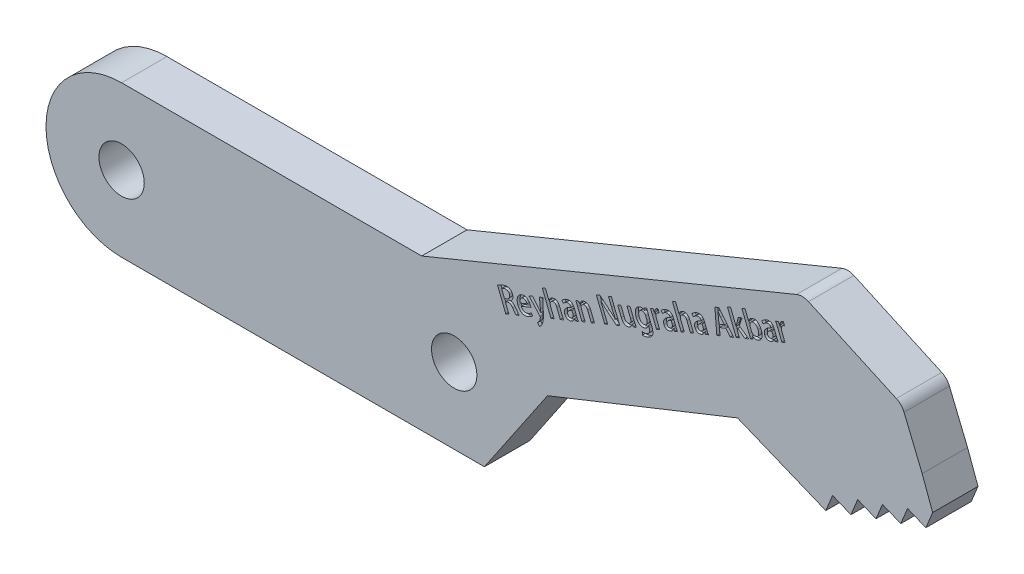
from build123d import *

# Parameters (mm, degrees)
SKETCH1_R           = 1.5
BOSS_EXTRUDE1_DEPTH = 3
CUT_EXTRUDE1_DEPTH  = 0.2


with BuildPart() as part:
    # Sketch1 → Boss-Extrude1 (new body)
    with BuildSketch(Plane.XY):
        with BuildLine():
            Line((0, 5), (19.85, 5))
            Line((19.85, 5), (44.643069029, 15.193663072))
            ThreePointArc((44.643069029, 15.193663072), (45.042006379, 15.268610471), (45.43786686, 15.178818479))
            Line((45.43786686, 15.178818479), (51.245085043, 12.533540635))
            ThreePointArc((51.245085043, 12.533540635), (51.550738574, 12.317286013), (51.755428853, 12.003770413))
            Line((51.755428853, 12.003770413), (52.954960556, 9.086264498))
            Line((52.954960556, 9.086264498), (53.647413738, 7.201821951))
            Line((53.647413738, 7.201821951), (53.200417763, 6.109762155))
            Line((53.200417763, 6.109762155), (51.987413738, 6.606262365))
            Line((51.987413738, 6.606262365), (51.540417763, 5.514202569))
            Line((51.540417763, 5.514202569), (50.327413738, 6.010702778))
            Line((50.327413738, 6.010702778), (49.901790908, 4.970859901))
            Line((49.901790908, 4.970859901), (48.688786884, 5.467360111))
            Line((48.688786884, 5.467360111), (48.241790908, 4.375300315))
            Line((48.241790908, 4.375300315), (47.028786884, 4.871800524))
            Line((47.028786884, 4.871800524), (46.581790908, 3.779740729))
            Line((46.581790908, 3.779740729), (40.742047423, 6.170032768))
            Line((40.742047423, 6.170032768), (28.174379319, 1.158584034))
            Line((28.174379319, 1.158584034), (24, -5))
            Line((24, -5), (22, -5))
            Line((22, -5), (0, -5))
            ThreePointArc((0, -5), (-5, 0), (0, 5))
        make_face()
        Circle(SKETCH1_R, mode=Mode.SUBTRACT)
        with Locations((22, 0)):
            Circle(SKETCH1_R, mode=Mode.SUBTRACT)
    extrude(amount=BOSS_EXTRUDE1_DEPTH)

    # Sketch2 → Cut-Extrude1 (cut)
    # profile 1 of 18: a face of its own
    with BuildSketch(Plane.XY.offset(3)):
        with BuildLine():
            add(Edge.make_bspline(
                [(25.743572611, 5.372251072), (25.750987597, 5.379191934), (25.765732774, 5.392994283), (25.785710215, 5.415520774), (25.804284298, 5.438807263), (25.821077113, 5.463175657), (25.835810927, 5.488836343), (25.848880382, 5.515538746), (25.860214773, 5.543263246), (25.869623191, 5.571931404), (25.876788923, 5.601482736), (25.881238125, 5.631745503), (25.883352923, 5.662655364), (25.882341078, 5.694037559), (25.879028246, 5.726007332), (25.872548193, 5.758446031), (25.863936171, 5.791555733), (25.856159378, 5.813432737), (25.852214656, 5.824529691)],
                knots=[0, 0, 0, 0, 0.981188857, 1.951157103, 2.90670332, 3.859102545, 4.80830042, 5.763977536, 6.730586948, 7.700899032, 8.677678365, 9.665662973, 10.65398515, 11.668003952, 12.696638376, 13.756891146, 14.862199065, 16, 16, 16, 16], degree=3))
            add(Edge.make_bspline(
                [(25.852214656, 5.824529691), (25.846240121, 5.838450591), (25.834572043, 5.86563767), (25.813079408, 5.903379495), (25.789517264, 5.937823402), (25.763194301, 5.968445459), (25.734228132, 5.99535671), (25.70301587, 6.018785223), (25.668955718, 6.0382747), (25.644758239, 6.048240513), (25.632543413, 6.05327123)],
                knots=[0, 0, 0, 0, 1.1114252, 2.170578402, 3.182689107, 4.171327386, 5.128410475, 6.080124226, 7.030851575, 8, 8, 8, 8], degree=3))
            add(Edge.make_bspline(
                [(25.632543413, 6.05327123), (25.617525656, 6.058100784), (25.58708097, 6.067891479), (25.538812227, 6.075505927), (25.488144585, 6.077765699), (25.434883339, 6.074083351), (25.378595736, 6.065062723), (25.319186198, 6.050661532), (25.256196263, 6.031352662), (25.213796073, 6.014994814), (25.191783695, 6.006502514)],
                knots=[0, 0, 0, 0, 0.834428026, 1.691590704, 2.578159835, 3.515786964, 4.513657022, 5.593819668, 6.750813335, 8, 8, 8, 8], degree=3))
            add(Edge.make_bspline(
                [(25.191783695, 6.006502514), (25.160850031, 5.993669429), (25.100089773, 5.968462539), (25.027048369, 5.933094919), (24.971885174, 5.904415642), (24.933728016, 5.883489475), (24.898191781, 5.863079942), (24.875618815, 5.849329828), (24.864686129, 5.842670284)],
                knots=[0, 0, 0, 0, 1.645601733, 3.232309778, 3.986213771, 4.701069559, 5.370893565, 6, 6, 6, 6], degree=3))
            Line((24.864686129, 5.842670284), (25.411645378, 4.468626663))
            Line((25.411645378, 4.468626663), (25.62094341, 4.551900222))
            Line((25.62094341, 4.551900222), (25.386329208, 5.141574677))
            Line((25.386329208, 5.141574677), (25.513728011, 5.192262931))
            add(Edge.make_bspline(
                [(25.513728011, 5.192262931), (25.522479264, 5.195687942), (25.539646668, 5.202406813), (25.565591577, 5.209644629), (25.590791388, 5.214644321), (25.615106796, 5.216932261), (25.638677096, 5.216697916), (25.661410324, 5.213874377), (25.683409362, 5.208493053), (25.704634542, 5.200325795), (25.725615106, 5.189864988), (25.745966438, 5.175852703), (25.766751918, 5.159743889), (25.787526061, 5.140693037), (25.807755815, 5.118422093), (25.828224639, 5.093600747), (25.848993181, 5.066242053), (25.861970007, 5.046456223), (25.868654568, 5.036264239)],
                knots=[0, 0, 0, 0, 1.045322281, 2.050617098, 2.993069074, 3.901286352, 4.763602442, 5.611370451, 6.445331311, 7.277301016, 8.137884323, 9.047804433, 10.021702193, 11.063616159, 12.179820649, 13.367301255, 14.643856522, 16, 16, 16, 16], degree=3))
            add(Edge.make_bspline(
                [(25.868654568, 5.036264239), (25.881190375, 5.017253418), (25.905151382, 4.980916036), (25.940007472, 4.92909218), (25.972576463, 4.882807161), (26.002143748, 4.841647165), (26.028912092, 4.806655031), (26.051630852, 4.777469431), (26.071155757, 4.755237378), (26.083362846, 4.743037926), (26.088609257, 4.737794797)],
                knots=[0, 0, 0, 0, 1.471986555, 2.813562662, 4.036879714, 5.13024976, 6.089123924, 6.884605429, 7.520621271, 8, 8, 8, 8], degree=3))
            Line((26.088609257, 4.737794797), (26.307076958, 4.824892673))
            add(Edge.make_bspline(
                [(26.307076958, 4.824892673), (26.300200107, 4.831480742), (26.284667237, 4.846361334), (26.261102941, 4.87373609), (26.23360965, 4.907699614), (26.203111115, 4.948680616), (26.169533425, 4.995345555), (26.132819951, 5.0468022), (26.093492169, 5.102816219), (26.066565045, 5.14187467), (26.052611518, 5.162114603)],
                knots=[0, 0, 0, 0, 0.540024009, 1.219762101, 2.046857604, 3.019207628, 4.117156509, 5.308555829, 6.605304446, 8, 8, 8, 8], degree=3))
            add(Edge.make_bspline(
                [(26.052611518, 5.162114603), (26.041310245, 5.178154299), (26.019541032, 5.209050958), (25.984313594, 5.251186387), (25.947675129, 5.286859832), (25.91052213, 5.317248427), (25.871618052, 5.3409253), (25.830929512, 5.357637359), (25.788338996, 5.367388989), (25.759388137, 5.368103515), (25.744788332, 5.368463847)],
                knots=[0, 0, 0, 0, 1.215739212, 2.341832317, 3.397717567, 4.380773461, 5.310668709, 6.208829296, 7.096719587, 8, 8, 8, 8], degree=3))
            Line((25.744788332, 5.368463847), (25.743572611, 5.372251072))
        make_face()
        with BuildLine():
            Line((25.323330951, 5.299913188), (25.132887941, 5.778568687))
            add(Edge.make_bspline(
                [(25.132887941, 5.778568687), (25.136166289, 5.780861302), (25.143417178, 5.785931996), (25.155297161, 5.793849031), (25.169885636, 5.801708938), (25.18638264, 5.810575525), (25.205575705, 5.819434667), (25.226540793, 5.829513598), (25.250153854, 5.839320173), (25.266521169, 5.846162803), (25.275117044, 5.849756453)],
                knots=[0, 0, 0, 0, 0.602360623, 1.332271771, 2.147437928, 3.095493607, 4.151675125, 5.328982467, 6.597220624, 8, 8, 8, 8], degree=3))
            add(Edge.make_bspline(
                [(25.275117044, 5.849756453), (25.284599488, 5.853611985), (25.303225859, 5.861185408), (25.331696323, 5.869431936), (25.359553844, 5.876179517), (25.387051167, 5.880405155), (25.414062837, 5.882442104), (25.440618155, 5.882174465), (25.466697379, 5.879605953), (25.492299635, 5.874903253), (25.517102019, 5.867379254), (25.540583342, 5.856179154), (25.56248267, 5.841519807), (25.583201044, 5.82377264), (25.60215558, 5.802280045), (25.619637686, 5.777481125), (25.636048685, 5.74948796), (25.645120692, 5.729108092), (25.649833666, 5.718520601)],
                knots=[0, 0, 0, 0, 1.085125214, 2.131511997, 3.140411754, 4.124156254, 5.078881449, 6.011034124, 6.937511951, 7.855493799, 8.768483149, 9.678552159, 10.604216454, 11.556518618, 12.564472057, 13.635199429, 14.771468669, 16, 16, 16, 16], degree=3))
            add(Edge.make_bspline(
                [(25.649833666, 5.718520601), (25.653237243, 5.709132791), (25.659853229, 5.690884455), (25.666401295, 5.66301766), (25.669985199, 5.635774187), (25.671491643, 5.608977586), (25.668917082, 5.582759861), (25.664148763, 5.557008333), (25.656589351, 5.531711707), (25.645584432, 5.507345068), (25.632324359, 5.483664734), (25.616093248, 5.461277509), (25.597258515, 5.440338859), (25.576144101, 5.420404369), (25.551874456, 5.402568439), (25.525487866, 5.385417168), (25.496413893, 5.369702795), (25.475684998, 5.360835252), (25.465026376, 5.356275636)],
                knots=[0, 0, 0, 0, 1.045771389, 2.03280513, 2.991984085, 3.923527726, 4.837864314, 5.744718788, 6.665572317, 7.596484331, 8.540883224, 9.505412933, 10.487168648, 11.488940569, 12.54241718, 13.638221026, 14.78559327, 16, 16, 16, 16], degree=3))
            Line((25.465026376, 5.356275636), (25.323330951, 5.299913188))
        make_face(mode=Mode.SUBTRACT)
    # profile 2 of 18: a face of its own
    with BuildSketch(Plane.XY.offset(3)):
        with BuildLine():
            add(Edge.make_bspline(
                [(27.098072371, 5.373106493), (27.083587102, 5.359585529), (27.053423249, 5.331429726), (27.010417209, 5.300533952), (26.971929068, 5.276267767), (26.938923366, 5.258497317), (26.902611854, 5.24128015), (26.877096929, 5.230487746), (26.863921538, 5.224914767)],
                knots=[0, 0, 0, 0, 1.27749339, 2.660228482, 3.407891251, 4.212627923, 5.077037237, 6, 6, 6, 6], degree=3))
            add(Edge.make_bspline(
                [(26.863921538, 5.224914767), (26.853883849, 5.220923754), (26.834104768, 5.213059535), (26.80360793, 5.205074693), (26.773499228, 5.199340401), (26.74363425, 5.195987893), (26.713922978, 5.19620724), (26.684402137, 5.198616687), (26.654990491, 5.20412586), (26.625907558, 5.212283996), (26.597209221, 5.223372066), (26.570241501, 5.239421871), (26.544118345, 5.258699426), (26.519864315, 5.282507468), (26.496762501, 5.309972299), (26.474911227, 5.341399121), (26.454252242, 5.376757887), (26.442151476, 5.402254591), (26.435916924, 5.415390993)],
                knots=[0, 0, 0, 0, 0.978569554, 1.928253344, 2.852323491, 3.75672776, 4.647643072, 5.541888152, 6.439123547, 7.355778368, 8.278417943, 9.218783269, 10.191938426, 11.215804626, 12.291812122, 13.442053279, 14.682095733, 16, 16, 16, 16], degree=3))
            Line((26.435916924, 5.415390993), (27.073154521, 5.668865199))
            add(Edge.make_bspline(
                [(27.073154521, 5.668865199), (27.069316443, 5.683186567), (27.061017784, 5.714152096), (27.049337902, 5.744012245), (27.043059893, 5.760062258)],
                knots=[0, 0, 0, 0, 0.924987764, 2, 2, 2, 2], degree=3))
            add(Edge.make_bspline(
                [(27.043059893, 5.760062258), (27.036665856, 5.775843313), (27.024113307, 5.806824126), (27.001767519, 5.851032077), (26.977052213, 5.892450876), (26.950266772, 5.931352904), (26.920900215, 5.967208992), (26.88928066, 6.00032103), (26.85521497, 6.030598381), (26.819174601, 6.058244958), (26.780811579, 6.081638394), (26.740048078, 6.0995078), (26.697286883, 6.111397628), (26.652501367, 6.117661649), (26.605837535, 6.118136804), (26.557333681, 6.112693908), (26.506789948, 6.102389128), (26.473318918, 6.091036014), (26.456041644, 6.085175697)],
                knots=[0, 0, 0, 0, 1.079260961, 2.118767288, 3.136925238, 4.135669961, 5.110612364, 6.072435361, 7.035600697, 7.997722153, 8.949096665, 9.877329575, 10.810498288, 11.754298042, 12.736849062, 13.760964235, 14.844241343, 16, 16, 16, 16], degree=3))
            add(Edge.make_bspline(
                [(26.456041644, 6.085175697), (26.438945486, 6.077405883), (26.405623247, 6.062261687), (26.359712952, 6.0340371), (26.31840154, 6.003009109), (26.282063265, 5.968311524), (26.250277151, 5.930569624), (26.223867188, 5.888959726), (26.201818368, 5.844378262), (26.185382518, 5.796553341), (26.173156947, 5.746840742), (26.165873055, 5.695564631), (26.163031805, 5.643399911), (26.164842976, 5.590212273), (26.171014064, 5.536048818), (26.182363416, 5.480874635), (26.197799153, 5.424636773), (26.21152469, 5.38752056), (26.218513256, 5.368622276)],
                knots=[0, 0, 0, 0, 1.064409217, 2.074647296, 3.05016383, 3.990364246, 4.918880881, 5.842184924, 6.779447399, 7.733825729, 8.704914782, 9.679709535, 10.667386565, 11.664846539, 12.69535615, 13.755980019, 14.857423178, 16, 16, 16, 16], degree=3))
            add(Edge.make_bspline(
                [(26.218513256, 5.368622276), (26.226447364, 5.349970227), (26.241979343, 5.313456581), (26.269551311, 5.262207271), (26.299623701, 5.215417825), (26.332390723, 5.17324225), (26.367565439, 5.135257158), (26.405613417, 5.101923889), (26.446534222, 5.073489055), (26.489564204, 5.049182983), (26.53496006, 5.030223583), (26.582109214, 5.016485932), (26.63089484, 5.008167959), (26.681392759, 5.005789747), (26.733438753, 5.008672137), (26.78700918, 5.017152358), (26.842224018, 5.030596369), (26.878677325, 5.043816544), (26.897368256, 5.050595007)],
                knots=[0, 0, 0, 0, 1.147323463, 2.246024616, 3.290799134, 4.293590701, 5.266476901, 6.218243215, 7.15185064, 8.083616567, 9.011688538, 9.931083564, 10.859047574, 11.807273331, 12.787838171, 13.805590414, 14.874846694, 16, 16, 16, 16], degree=3))
            add(Edge.make_bspline(
                [(26.897368256, 5.050595007), (26.913980012, 5.057507624), (26.946317215, 5.070964039), (26.992210164, 5.093473639), (27.034618543, 5.116694737), (27.07333257, 5.1407499), (27.108547638, 5.165045886), (27.139753778, 5.18941038), (27.167790789, 5.212823513), (27.18405444, 5.229414249), (27.191869445, 5.237386425)],
                knots=[0, 0, 0, 0, 1.229337843, 2.393085128, 3.491215565, 4.532222932, 5.506579311, 6.413225131, 7.237523427, 8, 8, 8, 8], degree=3))
            Line((27.191869445, 5.237386425), (27.098072371, 5.373106493))
        make_face()
        with BuildLine():
            add(Edge.make_bspline(
                [(26.377878708, 5.56720663), (26.373415889, 5.583304473), (26.364452488, 5.615636381), (26.359536858, 5.666229767), (26.360438154, 5.717952751), (26.366109552, 5.761391225), (26.374253051, 5.795776792), (26.384159376, 5.819917931), (26.396290673, 5.842676493), (26.411823584, 5.863432472), (26.430113548, 5.882537555), (26.451194291, 5.899910586), (26.475294107, 5.915277611), (26.492709145, 5.923959249), (26.501676573, 5.928429636)],
                knots=[0, 0, 0, 0, 1.427589357, 2.867259085, 4.331255366, 5.849013588, 6.608097361, 7.348468828, 8.075873379, 8.810213206, 9.559541106, 10.335117972, 11.142711608, 12, 12, 12, 12], degree=3))
            add(Edge.make_bspline(
                [(26.501676573, 5.928429636), (26.51153948, 5.931583422), (26.530660892, 5.937697729), (26.559407146, 5.942901207), (26.586770994, 5.94556412), (26.6128784, 5.943958339), (26.637720369, 5.939585523), (26.661227386, 5.931541916), (26.683363673, 5.920029748), (26.71062556, 5.900173855), (26.741112633, 5.871004806), (26.773040898, 5.83206035), (26.799567448, 5.789164598), (26.812024812, 5.757913655), (26.818286609, 5.742205112)],
                knots=[0, 0, 0, 0, 0.89861133, 1.742155514, 2.532850057, 3.280900212, 4.006967593, 4.718176007, 5.430378356, 6.166032418, 7.640953475, 9.081840507, 10.533163147, 12, 12, 12, 12], degree=3))
            Line((26.818286609, 5.742205112), (26.377878708, 5.56720663))
        make_face(mode=Mode.SUBTRACT)
    # profile 3 of 18: a face of its own
    with BuildSketch(Plane.XY.offset(3)):
        with BuildLine():
            Line((27.636885391, 6.542944612), (27.699383465, 5.914303424))
            add(Edge.make_bspline(
                [(27.699383465, 5.914303424), (27.701520641, 5.895282972), (27.705814353, 5.857069772), (27.712550121, 5.80035772), (27.719230296, 5.745554007), (27.723789856, 5.709949049), (27.725979574, 5.692849844)],
                knots=[0, 0, 0, 0, 1.029740385, 2.068808596, 3.072549472, 4, 4, 4, 4], degree=3))
            Line((27.725979574, 5.692849844), (27.720796983, 5.690933533))
            add(Edge.make_bspline(
                [(27.720796983, 5.690933533), (27.710646423, 5.704913868), (27.689426773, 5.734139627), (27.656301024, 5.778629937), (27.621759753, 5.824110672), (27.598180367, 5.854252802), (27.586523766, 5.869153731)],
                knots=[0, 0, 0, 0, 0.929030441, 1.942129375, 2.982680226, 4, 4, 4, 4], degree=3))
            Line((27.586523766, 5.869153731), (27.180069687, 6.361191018))
            Line((27.180069687, 6.361191018), (26.94893186, 6.269228044))
            Line((26.94893186, 6.269228044), (27.660760522, 5.481535022))
            add(Edge.make_bspline(
                [(27.660760522, 5.481535022), (27.664336847, 5.477769818), (27.670975254, 5.470780812), (27.67913566, 5.460257313), (27.685485375, 5.451053775), (27.687812205, 5.444788564), (27.688848048, 5.441999457)],
                knots=[0, 0, 0, 0, 1.273791898, 2.36442391, 3.271884596, 4, 4, 4, 4], degree=3))
            add(Edge.make_bspline(
                [(27.688848048, 5.441999457), (27.689894311, 5.439096304), (27.692335138, 5.432323534), (27.693687687, 5.419921849), (27.693798141, 5.404487125), (27.692954285, 5.385826975), (27.690470789, 5.364014825), (27.687189681, 5.338840725), (27.682144572, 5.310538248), (27.676540267, 5.279394357), (27.668658238, 5.246501144), (27.656781157, 5.213174999), (27.641820646, 5.179749373), (27.623183716, 5.146465637), (27.601267426, 5.113242425), (27.575908701, 5.080073002), (27.547266368, 5.046809505), (27.526187182, 5.025492325), (27.515378628, 5.014561737)],
                knots=[0, 0, 0, 0, 0.30843856, 0.719556711, 1.240446011, 1.856595938, 2.58964512, 3.440025361, 4.400525779, 5.470246343, 6.611661885, 7.785607312, 9.010499543, 10.27788074, 11.604170266, 12.996167454, 14.45975616, 16, 16, 16, 16], degree=3))
            Line((27.515378628, 5.014561737), (27.641065124, 4.858137045))
            add(Edge.make_bspline(
                [(27.641065124, 4.858137045), (27.647341661, 4.862459438), (27.660966432, 4.871842258), (27.681225567, 4.889489462), (27.703680375, 4.910816484), (27.72782912, 4.936069435), (27.752916143, 4.965433405), (27.777097093, 4.999574865), (27.800794573, 5.037957517), (27.814987592, 5.065663181), (27.822351474, 5.080037939)],
                knots=[0, 0, 0, 0, 0.631187978, 1.370148969, 2.223164076, 3.19796146, 4.264787326, 5.420880802, 6.661854269, 8, 8, 8, 8], degree=3))
            add(Edge.make_bspline(
                [(27.822351474, 5.080037939), (27.826826586, 5.090284505), (27.835955484, 5.111186739), (27.847437984, 5.144096954), (27.857502074, 5.178895064), (27.867139212, 5.215363172), (27.874395416, 5.25399349), (27.881442202, 5.294283009), (27.8867577, 5.336566176), (27.890572982, 5.380927092), (27.893742455, 5.427797124), (27.895967596, 5.477508068), (27.897275697, 5.530334439), (27.898209191, 5.586175674), (27.898152318, 5.645139373), (27.897304023, 5.707219364), (27.895528446, 5.772411273), (27.893996902, 5.816905991), (27.893213165, 5.839675268)],
                knots=[0, 0, 0, 0, 0.697712567, 1.423281985, 2.173432346, 2.958692266, 3.776388953, 4.625693482, 5.511518337, 6.435206848, 7.404550176, 8.443560637, 9.540869452, 10.702787886, 11.929442788, 13.221090037, 14.57794874, 16, 16, 16, 16], degree=3))
            Line((27.893213165, 5.839675268), (27.858923303, 6.631286997))
            Line((27.858923303, 6.631286997), (27.636885391, 6.542944612))
        make_face()
    # profile 4 of 18: a face of its own
    with BuildSketch(Plane.XY.offset(3)):
        with BuildLine():
            add(Edge.make_bspline(
                [(28.99091969, 6.634588379), (28.982499791, 6.652945217), (28.966272564, 6.688323381), (28.940002029, 6.738187647), (28.912368467, 6.782608215), (28.883124126, 6.821207323), (28.853100216, 6.854615692), (28.821411533, 6.882016645), (28.788664519, 6.904213868), (28.754707779, 6.920655271), (28.720532611, 6.932260173), (28.687051118, 6.94129007), (28.654007247, 6.94674267), (28.621626302, 6.948685118), (28.589798838, 6.947651958), (28.558621035, 6.943098758), (28.528014852, 6.935159743), (28.508438458, 6.927427637), (28.498588438, 6.923537166)],
                knots=[0, 0, 0, 0, 1.508332757, 2.906930038, 4.207087733, 5.4110806, 6.520046637, 7.555743631, 8.53246312, 9.466726067, 10.363978269, 11.22500083, 12.054559279, 12.860609597, 13.644481132, 14.428956048, 15.209516602, 16, 16, 16, 16], degree=3))
            add(Edge.make_bspline(
                [(28.498588438, 6.923537166), (28.484997936, 6.917545857), (28.457791597, 6.905552071), (28.420073382, 6.881417932), (28.385242808, 6.852799535), (28.353425132, 6.819981468), (28.325733614, 6.78297095), (28.302719431, 6.742178324), (28.285012471, 6.697812452), (28.277582718, 6.666470941), (28.273815154, 6.650577932)],
                knots=[0, 0, 0, 0, 0.965888304, 1.933577179, 2.903980146, 3.89590482, 4.902316441, 5.904941962, 6.937614229, 8, 8, 8, 8], degree=3))
            Line((28.273815154, 6.650577932), (28.270396631, 6.649369961))
            Line((28.270396631, 6.649369961), (28.034334194, 7.242684382))
            Line((28.034334194, 7.242684382), (27.823216179, 7.158686705))
            Line((27.823216179, 7.158686705), (28.40395874, 5.699060431))
            Line((28.40395874, 5.699060431), (28.615076754, 5.783058108))
            Line((28.615076754, 5.783058108), (28.37104902, 6.39639234))
            add(Edge.make_bspline(
                [(28.37104902, 6.39639234), (28.367865388, 6.405771828), (28.361652952, 6.424074654), (28.355168847, 6.451665549), (28.35110701, 6.478397114), (28.349634804, 6.50421778), (28.350758809, 6.52919949), (28.354389369, 6.553259069), (28.360673801, 6.576465097), (28.369538715, 6.598516372), (28.38020889, 6.619216143), (28.392231828, 6.63848286), (28.405537491, 6.656011488), (28.420041617, 6.672060405), (28.436003867, 6.686317512), (28.453354812, 6.698742151), (28.471816708, 6.709669989), (28.484918301, 6.715428083), (28.491502269, 6.718321709)],
                knots=[0, 0, 0, 0, 1.242783123, 2.425126558, 3.55228797, 4.633199405, 5.666131901, 6.685976196, 7.681461027, 8.676945858, 9.663559679, 10.601420432, 11.524160725, 12.422492109, 13.31288081, 14.204926784, 15.097918389, 16, 16, 16, 16], degree=3))
            add(Edge.make_bspline(
                [(28.491502269, 6.718321709), (28.500138843, 6.721260065), (28.516817456, 6.726934504), (28.54205033, 6.731973009), (28.566182446, 6.734434435), (28.589466602, 6.733626807), (28.611665062, 6.729591336), (28.632916284, 6.722813875), (28.65303291, 6.712689433), (28.678349853, 6.694943857), (28.707820515, 6.667590673), (28.738801447, 6.628123467), (28.766326017, 6.582168847), (28.780398674, 6.548088471), (28.787704138, 6.530396504)],
                knots=[0, 0, 0, 0, 0.826115164, 1.595361348, 2.326528009, 3.020696809, 3.699372396, 4.365614178, 5.035862063, 5.731877411, 7.162315087, 8.661646517, 10.266978081, 12, 12, 12, 12], degree=3))
            Line((28.787704138, 6.530396504), (29.020932938, 5.944536401))
            Line((29.020932938, 5.944536401), (29.232050953, 6.028534078))
            Line((29.232050953, 6.028534078), (28.99091969, 6.634588379))
        make_face()
    # profile 5 of 18: a face of its own
    with BuildSketch(Plane.XY.offset(3)):
        with BuildLine():
            add(Edge.make_bspline(
                [(29.951555727, 7.043927386), (29.946183873, 7.057428107), (29.935608593, 7.084006254), (29.917185191, 7.122105603), (29.896477479, 7.157676092), (29.87345417, 7.190603937), (29.84845238, 7.221040635), (29.821448562, 7.249040293), (29.792115427, 7.274213307), (29.761005605, 7.297156557), (29.727353916, 7.316501453), (29.690379775, 7.330170527), (29.650776554, 7.338682622), (29.60825862, 7.341594283), (29.563115264, 7.339461915), (29.515095628, 7.332151471), (29.464365137, 7.31963359), (29.430234484, 7.307769286), (29.412560667, 7.301625614)],
                knots=[0, 0, 0, 0, 1.020237711, 2.008487254, 2.969014152, 3.907819502, 4.827098827, 5.7327706, 6.636032665, 7.538563244, 8.444745344, 9.351850162, 10.295427227, 11.280195435, 12.336267746, 13.46331323, 14.686431846, 16, 16, 16, 16], degree=3))
            add(Edge.make_bspline(
                [(29.412560667, 7.301625614), (29.396118578, 7.294556935), (29.363831713, 7.28067637), (29.318071994, 7.256791601), (29.275409467, 7.2313885), (29.237015557, 7.203501555), (29.201804724, 7.175430691), (29.170993988, 7.146853786), (29.144191031, 7.118461155), (29.129052188, 7.098618897), (29.121744287, 7.08904054)],
                knots=[0, 0, 0, 0, 1.1777533, 2.312720773, 3.395375008, 4.443019484, 5.43378956, 6.358020496, 7.207375154, 8, 8, 8, 8], degree=3))
            Line((29.121744287, 7.08904054), (29.221405996, 6.966339093))
            add(Edge.make_bspline(
                [(29.221405996, 6.966339093), (29.227647022, 6.974743994), (29.240392737, 6.991908876), (29.262248118, 7.016167509), (29.286806207, 7.039432266), (29.313493778, 7.061740831), (29.342433541, 7.082269708), (29.372617321, 7.101281594), (29.404316631, 7.118241245), (29.426374042, 7.127656869), (29.437503983, 7.132407895)],
                knots=[0, 0, 0, 0, 0.909700375, 1.85783267, 2.8338391, 3.848679995, 4.878926387, 5.915863078, 6.948366166, 8, 8, 8, 8], degree=3))
            add(Edge.make_bspline(
                [(29.437503983, 7.132407895), (29.449357112, 7.13617492), (29.472004973, 7.143372601), (29.505168663, 7.150890709), (29.535647041, 7.154624908), (29.563489182, 7.155333822), (29.588716439, 7.151538687), (29.611469252, 7.144623571), (29.631477943, 7.133725731), (29.653374738, 7.114383543), (29.675857508, 7.087654502), (29.699367038, 7.055439317), (29.717032469, 7.022587898), (29.724822668, 6.999964559), (29.72860381, 6.988983832)],
                knots=[0, 0, 0, 0, 1.188650817, 2.271163927, 3.244686521, 4.120829855, 4.924265198, 5.672662562, 6.384123798, 7.082625149, 8.452265365, 9.715347135, 10.891094328, 12, 12, 12, 12], degree=3))
            add(Edge.make_bspline(
                [(29.72860381, 6.988983832), (29.707521229, 6.980345104), (29.666492134, 6.963533158), (29.608340203, 6.934947005), (29.554649171, 6.905373649), (29.505721221, 6.874098276), (29.461234505, 6.841534247), (29.42148919, 6.807253035), (29.386297344, 6.771472063), (29.356233606, 6.734038115), (29.330968958, 6.695479817), (29.311472238, 6.655497376), (29.297727214, 6.614336189), (29.289592466, 6.572008965), (29.287862302, 6.528521573), (29.291217535, 6.483959728), (29.300679453, 6.438264698), (29.311114878, 6.408285831), (29.316472214, 6.392895287)],
                knots=[0, 0, 0, 0, 1.340197143, 2.608175759, 3.810102818, 4.945089011, 6.022482777, 7.051159955, 8.030022594, 8.971140373, 9.871648839, 10.73687335, 11.580688119, 12.418032271, 13.26391376, 14.133698115, 15.041878329, 16, 16, 16, 16], degree=3))
            add(Edge.make_bspline(
                [(29.316472214, 6.392895287), (29.320618202, 6.383158966), (29.328813176, 6.363914123), (29.344364872, 6.337236521), (29.361010327, 6.312088657), (29.380287503, 6.289549846), (29.400835243, 6.268252238), (29.423888553, 6.249747418), (29.448629905, 6.233055575), (29.474974545, 6.218374053), (29.5029545, 6.206443336), (29.532148081, 6.197814594), (29.562418193, 6.192816942), (29.593665592, 6.190768799), (29.625967785, 6.192283286), (29.659262218, 6.197214092), (29.693583775, 6.205440694), (29.716377581, 6.213192924), (29.728036916, 6.217158293)],
                knots=[0, 0, 0, 0, 1.012672092, 2.001650993, 2.953017408, 3.897427623, 4.838188098, 5.783811763, 6.722611183, 7.694842445, 8.668126247, 9.630364796, 10.60343818, 11.600993395, 12.62468667, 13.694700017, 14.820808445, 16, 16, 16, 16], degree=3))
            add(Edge.make_bspline(
                [(29.728036916, 6.217158293), (29.743121807, 6.223930454), (29.772451547, 6.237097648), (29.812860525, 6.261631651), (29.848192935, 6.289926509), (29.878988066, 6.321109776), (29.904673806, 6.35498689), (29.926077058, 6.390166883), (29.943004225, 6.426843293), (29.950298262, 6.452400261), (29.953943987, 6.465174212)],
                knots=[0, 0, 0, 0, 1.138873426, 2.214325649, 3.24755042, 4.251362901, 5.226854647, 6.170508694, 7.085578824, 8, 8, 8, 8], degree=3))
            Line((29.953943987, 6.465174212), (29.959589948, 6.467399712))
            Line((29.959589948, 6.467399712), (30.020493357, 6.356713751))
            Line((30.020493357, 6.356713751), (30.21159156, 6.432746131))
            add(Edge.make_bspline(
                [(30.21159156, 6.432746131), (30.201683367, 6.449170575), (30.180855125, 6.48369678), (30.154048017, 6.5405356), (30.127452906, 6.601641115), (30.110492609, 6.643890669), (30.101903198, 6.665287628)],
                knots=[0, 0, 0, 0, 0.893502521, 1.878252419, 2.925457385, 4, 4, 4, 4], degree=3))
            Line((30.101903198, 6.665287628), (29.951555727, 7.043927386))
        make_face()
        with BuildLine():
            add(Edge.make_bspline(
                [(29.8566877, 6.683644681), (29.859063494, 6.676136689), (29.863721545, 6.661416303), (29.868923789, 6.6393106), (29.871857059, 6.617474231), (29.872334817, 6.596012186), (29.870989235, 6.574733518), (29.867309917, 6.553816654), (29.861285295, 6.53320009), (29.850285092, 6.50664076), (29.832642612, 6.475237635), (29.803743895, 6.44306449), (29.76903743, 6.415715974), (29.742127938, 6.402881941), (29.728320363, 6.396296648)],
                knots=[0, 0, 0, 0, 0.810642024, 1.589368208, 2.335068682, 3.074652577, 3.796165889, 4.527061744, 5.256661684, 6.00274278, 7.484467473, 8.938632533, 10.42917662, 12, 12, 12, 12], degree=3))
            add(Edge.make_bspline(
                [(29.728320363, 6.396296648), (29.718410361, 6.392769938), (29.699066544, 6.38588598), (29.668726417, 6.382620474), (29.638861124, 6.384983357), (29.60941804, 6.392742739), (29.581210141, 6.407738603), (29.556328286, 6.431051839), (29.534236222, 6.461401523), (29.523074234, 6.485164006), (29.517152523, 6.49777059)],
                knots=[0, 0, 0, 0, 0.953280181, 1.860754296, 2.747849753, 3.664378621, 4.609424644, 5.61850079, 6.736555845, 8, 8, 8, 8], degree=3))
            add(Edge.make_bspline(
                [(29.517152523, 6.49777059), (29.513858458, 6.508569612), (29.507520106, 6.529348796), (29.502678642, 6.560610458), (29.501862659, 6.590400329), (29.505879842, 6.618731395), (29.514207842, 6.64553758), (29.526913789, 6.670750427), (29.543843905, 6.69463008), (29.572808415, 6.72379004), (29.614133289, 6.757000749), (29.668132378, 6.792949214), (29.727263768, 6.824103233), (29.769250311, 6.840749138), (29.790678651, 6.849244578)],
                knots=[0, 0, 0, 0, 0.809683319, 1.55797047, 2.263534821, 2.941734914, 3.60251372, 4.269874496, 4.960610951, 5.694588713, 7.212727652, 8.759136856, 10.345986297, 12, 12, 12, 12], degree=3))
            Line((29.790678651, 6.849244578), (29.8566877, 6.683644681))
        make_face(mode=Mode.SUBTRACT)
    # profile 6 of 18: a face of its own
    with BuildSketch(Plane.XY.offset(3)):
        with BuildLine():
            add(Edge.make_bspline(
                [(31.03491963, 7.48344917), (31.026737888, 7.501471866), (31.010970937, 7.536203215), (30.984916566, 7.584889852), (30.957545586, 7.628093953), (30.928739795, 7.665860788), (30.898862256, 7.698509781), (30.867068854, 7.725276047), (30.834499873, 7.74730345), (30.800300455, 7.76306892), (30.766050504, 7.774498085), (30.732214842, 7.782887358), (30.698880652, 7.78770114), (30.666059361, 7.789408866), (30.633626851, 7.788210835), (30.601765468, 7.782853534), (30.570295159, 7.774735464), (30.550044648, 7.766839023), (30.539815914, 7.762850452)],
                knots=[0, 0, 0, 0, 1.481728579, 2.855423864, 4.131038393, 5.306861738, 6.408110835, 7.437117003, 8.41228438, 9.342698575, 10.246509574, 11.113003486, 11.949402386, 12.764067413, 13.571326801, 14.373829425, 15.178605124, 16, 16, 16, 16], degree=3))
            add(Edge.make_bspline(
                [(30.539815914, 7.762850452), (30.521996305, 7.754614603), (30.487504549, 7.738673239), (30.441338186, 7.708011137), (30.401615594, 7.67353738), (30.36998182, 7.634537262), (30.344448092, 7.593976899), (30.324816394, 7.553073459), (30.31054382, 7.512205798), (30.306147131, 7.484503205), (30.303988206, 7.470900285)],
                knots=[0, 0, 0, 0, 1.196845955, 2.316623091, 3.370863069, 4.395142185, 5.369675507, 6.290646148, 7.1606488, 8, 8, 8, 8], degree=3))
            Line((30.303988206, 7.470900285), (30.29870209, 7.468797409))
            Line((30.29870209, 7.468797409), (30.228404524, 7.613691298))
            Line((30.228404524, 7.613691298), (30.044586253, 7.540555389))
            add(Edge.make_bspline(
                [(30.044586253, 7.540555389), (30.053935528, 7.519312138), (30.072980432, 7.476038658), (30.102754204, 7.409455778), (30.133181137, 7.337543147), (30.153368036, 7.287448006), (30.163965505, 7.261149679)],
                knots=[0, 0, 0, 0, 0.916577745, 1.867111031, 2.880302352, 4, 4, 4, 4], degree=3))
            Line((30.163965505, 7.261149679), (30.450855151, 6.540641291))
            Line((30.450855151, 6.540641291), (30.661973165, 6.624638968))
            Line((30.661973165, 6.624638968), (30.421566021, 7.228873286))
            add(Edge.make_bspline(
                [(30.421566021, 7.228873286), (30.418108301, 7.238824863), (30.411392333, 7.258153925), (30.404375335, 7.287197539), (30.399751551, 7.315046739), (30.397596311, 7.341899557), (30.398493239, 7.367743599), (30.401867321, 7.392543029), (30.407790246, 7.416377107), (30.416677617, 7.438878427), (30.427361949, 7.459961899), (30.439481085, 7.479360073), (30.45227151, 7.497506169), (30.467353459, 7.513127664), (30.482784384, 7.528029869), (30.500283559, 7.540288855), (30.518704936, 7.551259493), (30.531811975, 7.557011834), (30.53839868, 7.559902569)],
                knots=[0, 0, 0, 0, 1.291864316, 2.509202736, 3.660219682, 4.752846804, 5.808255154, 6.826271909, 7.818691315, 8.813207074, 9.787797748, 10.714255702, 11.618474542, 12.504303114, 13.373750136, 14.245589251, 15.118352578, 16, 16, 16, 16], degree=3))
            add(Edge.make_bspline(
                [(30.53839868, 7.559902569), (30.547137331, 7.562807188), (30.564039529, 7.568425268), (30.589386309, 7.573904005), (30.613743029, 7.576275819), (30.63702836, 7.575535558), (30.659219944, 7.571422702), (30.680443142, 7.56461732), (30.700595934, 7.554678731), (30.725904201, 7.537100529), (30.754874185, 7.509703818), (30.78577096, 7.47065537), (30.812456098, 7.424907052), (30.826486367, 7.391340027), (30.833750209, 7.373961491)],
                knots=[0, 0, 0, 0, 0.837579779, 1.620037158, 2.354089541, 3.059590137, 3.732483314, 4.401354576, 5.081948822, 5.768760151, 7.198523646, 8.691691895, 10.287201515, 12, 12, 12, 12], degree=3))
            Line((30.833750209, 7.373961491), (31.067829349, 6.786117261))
            Line((31.067829349, 6.786117261), (31.278947364, 6.870114938))
            Line((31.278947364, 6.870114938), (31.03491963, 7.48344917))
        make_face()
    # profile 7 of 18: a face of its own
    with BuildSketch(Plane.XY.offset(3)):
        with BuildLine():
            Line((32.398403181, 8.948029654), (32.203665012, 8.870549038))
            Line((32.203665012, 8.870549038), (32.407866262, 8.357313864))
            add(Edge.make_bspline(
                [(32.407866262, 8.357313864), (32.41863064, 8.330238265), (32.439740716, 8.27714017), (32.471965139, 8.199350533), (32.50333782, 8.124575023), (32.544435697, 8.028998091), (32.597076138, 7.912732632), (32.641926673, 7.82159076), (32.664279568, 7.776166894)],
                knots=[0, 0, 0, 0, 0.825393632, 1.618683617, 2.385206966, 3.122543452, 4.565914921, 6, 6, 6, 6], degree=3))
            Line((32.664279568, 7.776166894), (32.659584427, 7.772336487))
            add(Edge.make_bspline(
                [(32.659584427, 7.772336487), (32.628478774, 7.803871751), (32.56545075, 7.867770277), (32.465781752, 7.960860656), (32.36063276, 8.053091042), (32.287481646, 8.112745587), (32.250447292, 8.142947007)],
                knots=[0, 0, 0, 0, 0.962168359, 1.949599658, 2.96193992, 4, 4, 4, 4], degree=3))
            Line((32.250447292, 8.142947007), (31.630370403, 8.642451898))
            Line((31.630370403, 8.642451898), (31.40105256, 8.551213042))
            Line((31.40105256, 8.551213042), (31.955002758, 7.158926134))
            Line((31.955002758, 7.158926134), (32.149740926, 7.23640675))
            Line((32.149740926, 7.23640675), (31.942643205, 7.756921855))
            add(Edge.make_bspline(
                [(31.942643205, 7.756921855), (31.930830312, 7.786297529), (31.907836902, 7.843476317), (31.874176017, 7.927002861), (31.841591724, 8.005675829), (31.800487364, 8.103112006), (31.750993083, 8.218435131), (31.709283684, 8.307917404), (31.688939252, 8.351563826)],
                knots=[0, 0, 0, 0, 0.881397634, 1.715611621, 2.506892799, 3.251845996, 4.659543582, 6, 6, 6, 6], degree=3))
            Line((31.688939252, 8.351563826), (31.695680247, 8.356439719))
            add(Edge.make_bspline(
                [(31.695680247, 8.356439719), (31.728121247, 8.323452006), (31.793804127, 8.256662201), (31.897939861, 8.161029442), (32.004997793, 8.067484545), (32.077891048, 8.006933233), (32.114109398, 7.976847203)],
                knots=[0, 0, 0, 0, 0.982057518, 1.98835941, 3.000479478, 4, 4, 4, 4], degree=3))
            Line((32.114109398, 7.976847203), (32.739415382, 7.471020951))
            Line((32.739415382, 7.471020951), (32.952353379, 7.555742746))
            Line((32.952353379, 7.555742746), (32.398403181, 8.948029654))
        make_face()
    # profile 8 of 18: a face of its own
    with BuildSketch(Plane.XY.offset(3)):
        with BuildLine():
            Line((33.635562024, 9.006060305), (33.424444009, 8.922062628))
            Line((33.424444009, 8.922062628), (33.671368215, 8.301448464))
            add(Edge.make_bspline(
                [(33.671368215, 8.301448464), (33.674530152, 8.292088977), (33.680672568, 8.273907125), (33.686739764, 8.246469523), (33.690985294, 8.220170591), (33.692080438, 8.194786758), (33.690680713, 8.170473477), (33.686858793, 8.147098873), (33.679822903, 8.124849637), (33.66797844, 8.097015512), (33.648805699, 8.065797301), (33.621566881, 8.033377439), (33.589280237, 8.007625973), (33.564760403, 7.996293769), (33.552490532, 7.990623067)],
                knots=[0, 0, 0, 0, 0.959463283, 1.863864945, 2.72748835, 3.54558323, 4.327471122, 5.09135709, 5.84075521, 6.589534202, 8.027369524, 9.38195037, 10.689912298, 12, 12, 12, 12], degree=3))
            add(Edge.make_bspline(
                [(33.552490532, 7.990623067), (33.544140002, 7.987681808), (33.527863849, 7.981948952), (33.503187682, 7.976940051), (33.47948238, 7.974755603), (33.456725273, 7.976030567), (33.434750626, 7.979730275), (33.41389483, 7.987457868), (33.393692954, 7.997625581), (33.374854112, 8.011513092), (33.356694234, 8.027704766), (33.339382303, 8.046319088), (33.322715897, 8.066967365), (33.306710331, 8.089884474), (33.291540565, 8.115012655), (33.27701269, 8.14247269), (33.26316511, 8.172070655), (33.25486235, 8.192865593), (33.250619728, 8.203491587)],
                knots=[0, 0, 0, 0, 1.013426883, 1.975286846, 2.877082097, 3.733476606, 4.580789553, 5.419761235, 6.271970989, 7.164292996, 8.092162062, 9.057245975, 10.073444946, 11.130685753, 12.257741331, 13.434654477, 14.689135563, 16, 16, 16, 16], degree=3))
            Line((33.250619728, 8.203491587), (33.026963622, 8.766024907))
            Line((33.026963622, 8.766024907), (32.815845608, 8.68202723))
            Line((32.815845608, 8.68202723), (33.053356281, 8.085072844))
            add(Edge.make_bspline(
                [(33.053356281, 8.085072844), (33.06144434, 8.066242902), (33.07703884, 8.029937095), (33.103123755, 7.979142967), (33.130300495, 7.933796881), (33.15866667, 7.89401238), (33.18773891, 7.85934064), (33.218280058, 7.830454199), (33.249725558, 7.806827846), (33.282563317, 7.789281973), (33.315552443, 7.775793818), (33.348812377, 7.766592126), (33.381995625, 7.760388738), (33.415185031, 7.758162249), (33.448463486, 7.759566371), (33.481571389, 7.764823228), (33.514945776, 7.773181672), (33.536422676, 7.781838097), (33.54738849, 7.78625795)],
                knots=[0, 0, 0, 0, 1.501430874, 2.894892532, 4.180864108, 5.372069253, 6.472268634, 7.491023405, 8.44652451, 9.345011408, 10.211585907, 11.053268869, 11.869477596, 12.681446555, 13.485346056, 14.304954202, 15.134532591, 16, 16, 16, 16], degree=3))
            add(Edge.make_bspline(
                [(33.54738849, 7.78625795), (33.557080585, 7.790582133), (33.576077835, 7.799057865), (33.603028947, 7.813466883), (33.6276296, 7.829210847), (33.650565606, 7.845293056), (33.671316112, 7.862653772), (33.690029195, 7.881010143), (33.706581494, 7.900399329), (33.72538746, 7.926842693), (33.744865831, 7.959906671), (33.763497424, 7.998741468), (33.77682482, 8.035779031), (33.781342481, 8.060275388), (33.783499645, 8.071972289)],
                knots=[0, 0, 0, 0, 0.985784152, 1.932212616, 2.835659487, 3.69787094, 4.532891029, 5.34598658, 6.130484257, 6.897803608, 8.357991028, 9.688996673, 10.896506234, 12, 12, 12, 12], degree=3))
            Line((33.783499645, 8.071972289), (33.789163321, 8.074264221))
            Line((33.789163321, 8.074264221), (33.85801265, 7.933010298))
            Line((33.85801265, 7.933010298), (34.043650905, 8.006870324))
            add(Edge.make_bspline(
                [(34.043650905, 8.006870324), (34.034001296, 8.027191842), (34.013733953, 8.069873692), (33.984539071, 8.137968213), (33.952407585, 8.212027657), (33.931175211, 8.263825594), (33.920120985, 8.290793191)],
                knots=[0, 0, 0, 0, 0.871665291, 1.830782881, 2.870638987, 4, 4, 4, 4], degree=3))
            Line((33.920120985, 8.290793191), (33.635562024, 9.006060305))
        make_face()
    # profile 9 of 18: a face of its own
    with BuildSketch(Plane.XY.offset(3)):
        with BuildLine():
            Line((34.543725305, 9.381650617), (34.588210116, 9.243351294))
            Line((34.588210116, 9.243351294), (34.58457015, 9.241903058))
            add(Edge.make_bspline(
                [(34.58457015, 9.241903058), (34.5748633, 9.249844068), (34.555245606, 9.265892971), (34.521510944, 9.285089095), (34.484439064, 9.300768268), (34.450986161, 9.310304389), (34.422531279, 9.315754351), (34.399930089, 9.317663104), (34.376529563, 9.317534177), (34.352241489, 9.315970076), (34.327182278, 9.311822502), (34.301200403, 9.306028033), (34.27427294, 9.29891291), (34.256420509, 9.292329554), (34.247303932, 9.288967677)],
                knots=[0, 0, 0, 0, 1.255189015, 2.536756492, 3.873539433, 5.282349469, 6.014198714, 6.774713949, 7.55127496, 8.358249714, 9.211466719, 10.093828336, 11.026588483, 12, 12, 12, 12], degree=3))
            add(Edge.make_bspline(
                [(34.247303932, 9.288967677), (34.233545609, 9.282940232), (34.206342333, 9.271022628), (34.168519042, 9.247995945), (34.133644704, 9.221684856), (34.10243968, 9.19111808), (34.073413251, 9.157745309), (34.0483624, 9.120007491), (34.026111087, 9.078952655), (34.007185617, 9.034500908), (33.992015653, 8.987157626), (33.982448421, 8.937006925), (33.978004047, 8.884680761), (33.978591315, 8.830004048), (33.984781349, 8.773124412), (33.996002593, 8.714032796), (34.012137352, 8.652625871), (34.026491255, 8.611626625), (34.033868518, 8.59055485)],
                knots=[0, 0, 0, 0, 0.884607199, 1.749065935, 2.603490113, 3.454330487, 4.31943493, 5.206143753, 6.118289565, 7.0690361, 8.050211751, 9.043141816, 10.071841185, 11.141289181, 12.261360882, 13.440055149, 14.684303035, 16, 16, 16, 16], degree=3))
            add(Edge.make_bspline(
                [(34.033868518, 8.59055485), (34.041365827, 8.573240239), (34.056021256, 8.539394354), (34.081780746, 8.491644796), (34.109426824, 8.447548475), (34.139641862, 8.407405275), (34.171995846, 8.370820823), (34.206993216, 8.338299657), (34.243916597, 8.308998684), (34.283286642, 8.284276641), (34.323868025, 8.263464241), (34.365501212, 8.247716133), (34.407755855, 8.237171957), (34.450628705, 8.23148853), (34.494213477, 8.230464312), (34.538374404, 8.2353446), (34.583165363, 8.244557613), (34.612472622, 8.254448937), (34.627406043, 8.259489029)],
                knots=[0, 0, 0, 0, 1.193165231, 2.33234997, 3.428460378, 4.482838012, 5.50736457, 6.513843048, 7.501509865, 8.48484451, 9.449842013, 10.382380003, 11.294230228, 12.198743756, 13.113430164, 14.044818102, 15.003743284, 16, 16, 16, 16], degree=3))
            add(Edge.make_bspline(
                [(34.627406043, 8.259489029), (34.642912774, 8.266378805), (34.673026805, 8.279758733), (34.713767659, 8.305715082), (34.749743212, 8.334561618), (34.779767174, 8.367464354), (34.804749817, 8.402546378), (34.82450186, 8.439383758), (34.839114913, 8.477787095), (34.844419545, 8.504383591), (34.847077285, 8.517709031)],
                knots=[0, 0, 0, 0, 1.146993952, 2.227459191, 3.259137002, 4.259257786, 5.231577885, 6.167075164, 7.0816636, 8, 8, 8, 8], degree=3))
            Line((34.847077285, 8.517709031), (34.850948658, 8.519408605))
            Line((34.850948658, 8.519408605), (34.889326907, 8.422949512))
            add(Edge.make_bspline(
                [(34.889326907, 8.422949512), (34.894314461, 8.409148752), (34.903969914, 8.382431727), (34.915109663, 8.342802468), (34.92245968, 8.305146002), (34.926997947, 8.269639866), (34.9277046, 8.23597467), (34.92445196, 8.204356103), (34.918478435, 8.174538132), (34.908319766, 8.146954633), (34.895446111, 8.121272158), (34.880148889, 8.097339446), (34.862085602, 8.075355951), (34.841569525, 8.055231638), (34.818738058, 8.036669549), (34.793428503, 8.019904926), (34.765537785, 8.005167752), (34.74576851, 7.996955378), (34.735682706, 7.992765624)],
                knots=[0, 0, 0, 0, 1.352143823, 2.617628498, 3.789119452, 4.885381262, 5.913028433, 6.884309113, 7.809942207, 8.707883575, 9.584071307, 10.453613753, 11.319923851, 12.200427804, 13.097989109, 14.027790454, 14.993826642, 16, 16, 16, 16], degree=3))
            add(Edge.make_bspline(
                [(34.735682706, 7.992765624), (34.721664459, 7.987674654), (34.694175639, 7.977691611), (34.652713982, 7.966021268), (34.612147418, 7.957809751), (34.572827751, 7.952666259), (34.535313984, 7.950566275), (34.500030565, 7.950205697), (34.467148008, 7.951684402), (34.446174407, 7.954542092), (34.436079477, 7.955917545)],
                knots=[0, 0, 0, 0, 1.172549049, 2.299288078, 3.383403635, 4.424794496, 5.414768116, 6.336115809, 7.199145848, 8, 8, 8, 8], degree=3))
            Line((34.436079477, 7.955917545), (34.454203184, 7.773398589))
            add(Edge.make_bspline(
                [(34.454203184, 7.773398589), (34.466848931, 7.771732225), (34.492902255, 7.768299108), (34.533349403, 7.767762888), (34.575855566, 7.77044883), (34.620085973, 7.776068309), (34.665153496, 7.78495562), (34.71054155, 7.795933422), (34.755451587, 7.809813115), (34.7849592, 7.820852137), (34.799741675, 7.826382373)],
                knots=[0, 0, 0, 0, 0.865775282, 1.783708247, 2.741688296, 3.757409633, 4.809638393, 5.860300286, 6.928071262, 8, 8, 8, 8], degree=3))
            add(Edge.make_bspline(
                [(34.799741675, 7.826382373), (34.813312364, 7.83268639), (34.839955581, 7.845063011), (34.877950692, 7.865227312), (34.913693037, 7.885535746), (34.94642179, 7.906916674), (34.977046912, 7.92832605), (35.004647372, 7.950835134), (35.030219076, 7.973334081), (35.052431524, 7.997128874), (35.072917419, 8.020773756), (35.09008925, 8.045545442), (35.104932041, 8.070659938), (35.117677957, 8.096186333), (35.127125644, 8.12260358), (35.134491353, 8.149476505), (35.138539186, 8.176982604), (35.141055685, 8.213902018), (35.140167075, 8.259438828), (35.137541998, 8.312875238), (35.132282912, 8.364388254), (35.123987318, 8.413865145), (35.113248479, 8.46129662), (35.099967654, 8.506791336), (35.083893643, 8.550295912), (35.070911077, 8.577978001), (35.064480953, 8.591688637)],
                knots=[0, 0, 0, 0, 1.151543718, 2.260815952, 3.309882129, 4.314446674, 5.268904835, 6.18433117, 7.054621088, 7.88793694, 8.687800885, 9.460524618, 10.203875502, 10.932422556, 11.652536266, 12.359904905, 13.073711574, 13.788221775, 15.206356861, 16.575499338, 17.906267591, 19.189118364, 20.434652175, 21.647398498, 22.834782141, 24, 24, 24, 24], degree=3))
            Line((35.064480953, 8.591688637), (34.837218375, 9.163236893))
            add(Edge.make_bspline(
                [(34.837218375, 9.163236893), (34.830800588, 9.179138484), (34.818439248, 9.209766637), (34.801773764, 9.254121935), (34.786140512, 9.294497585), (34.772843887, 9.33161738), (34.760835325, 9.365818084), (34.750029492, 9.397774581), (34.740105974, 9.427601016), (34.734050452, 9.446933615), (34.731147558, 9.456201268)],
                knots=[0, 0, 0, 0, 1.320444, 2.543315259, 3.648658349, 4.654427194, 5.579452512, 6.439964669, 7.252150945, 8, 8, 8, 8], degree=3))
            Line((34.731147558, 9.456201268), (34.543725305, 9.381650617))
        make_face()
        with BuildLine():
            add(Edge.make_bspline(
                [(34.743407461, 8.784401988), (34.746905816, 8.773962976), (34.753659438, 8.753810321), (34.761521203, 8.723856853), (34.766311697, 8.695104002), (34.768748126, 8.667513489), (34.768237303, 8.640987724), (34.764777923, 8.615625662), (34.758882384, 8.59145745), (34.750351186, 8.568641555), (34.739424081, 8.547641052), (34.72765402, 8.527771549), (34.713899404, 8.51003425), (34.699146071, 8.493579795), (34.682603358, 8.479139964), (34.664697827, 8.46643537), (34.645548111, 8.455077676), (34.631827809, 8.44924478), (34.624855022, 8.446280447)],
                knots=[0, 0, 0, 0, 1.318376664, 2.545143877, 3.704073494, 4.805392378, 5.857966453, 6.874148465, 7.86487484, 8.831661719, 9.783029212, 10.69705737, 11.593261542, 12.466307807, 13.340233568, 14.216281132, 15.09349715, 16, 16, 16, 16], degree=3))
            add(Edge.make_bspline(
                [(34.624855022, 8.446280447), (34.615090729, 8.442954394), (34.596006973, 8.436453812), (34.566903196, 8.430402381), (34.5384435, 8.428253825), (34.510544846, 8.428906155), (34.483161841, 8.433490612), (34.45650497, 8.44188003), (34.430272988, 8.453322372), (34.405034613, 8.468398184), (34.380547208, 8.486333665), (34.357330647, 8.507060256), (34.335447896, 8.530491699), (34.314747472, 8.556391011), (34.295128945, 8.584745477), (34.277094026, 8.615845548), (34.259859359, 8.649315657), (34.250060763, 8.673053873), (34.245036357, 8.685226069)],
                knots=[0, 0, 0, 0, 0.983366217, 1.921933394, 2.826073842, 3.700715035, 4.577860109, 5.464446284, 6.360328744, 7.301661248, 8.262466359, 9.251926178, 10.265714626, 11.317142889, 12.412128657, 13.551324002, 14.744397522, 16, 16, 16, 16], degree=3))
            add(Edge.make_bspline(
                [(34.245036357, 8.685226069), (34.240188388, 8.698600002), (34.230735327, 8.724677847), (34.218960628, 8.763578498), (34.210358812, 8.801271517), (34.205098513, 8.837684332), (34.20196913, 8.872615806), (34.202326969, 8.906296428), (34.205381962, 8.938647345), (34.211233249, 8.96953453), (34.220067721, 8.998581569), (34.231371828, 9.025454254), (34.244888488, 9.050256715), (34.261719829, 9.072098237), (34.28031832, 9.092213624), (34.301919904, 9.109533615), (34.325835864, 9.124778651), (34.343283527, 9.13271196), (34.352179234, 9.136756765)],
                knots=[0, 0, 0, 0, 1.318890647, 2.571706279, 3.766157782, 4.899818461, 5.980944185, 7.01474795, 8.018110222, 8.990591188, 9.924544632, 10.82758045, 11.690412711, 12.534949312, 13.377802979, 14.224744444, 15.094884282, 16, 16, 16, 16], degree=3))
            add(Edge.make_bspline(
                [(34.352179234, 9.136756765), (34.360344776, 9.139597176), (34.376272941, 9.14513784), (34.400674848, 9.150026916), (34.424554629, 9.153174686), (34.448137709, 9.152962151), (34.471232852, 9.150816074), (34.493918385, 9.145985105), (34.515958425, 9.138169761), (34.537555021, 9.128302185), (34.558080847, 9.116118071), (34.577568133, 9.102126199), (34.595666413, 9.08624564), (34.612454164, 9.068598212), (34.627805997, 9.049235794), (34.641709213, 9.02816705), (34.654302607, 9.005311905), (34.661447148, 8.989139667), (34.665104462, 8.980861044)],
                knots=[0, 0, 0, 0, 1.062655312, 2.072875143, 3.056447564, 4.021496351, 4.967873222, 5.90744025, 6.867151026, 7.840012971, 8.825096151, 9.799624195, 10.788405816, 11.783524754, 12.793142208, 13.825075442, 14.886648847, 16, 16, 16, 16], degree=3))
            Line((34.665104462, 8.980861044), (34.743407461, 8.784401988))
        make_face(mode=Mode.SUBTRACT)
    # profile 10 of 18: a face of its own
    with BuildSketch(Plane.XY.offset(3)):
        with BuildLine():
            add(Edge.make_bspline(
                [(35.482169177, 9.788484276), (35.473028829, 9.786577829), (35.454310859, 9.782673731), (35.436343021, 9.776130045), (35.427149226, 9.772781768)],
                knots=[0, 0, 0, 0, 0.9766387, 2, 2, 2, 2], degree=3))
            add(Edge.make_bspline(
                [(35.427149226, 9.772781768), (35.413757837, 9.766525145), (35.387119304, 9.754079291), (35.351628287, 9.727267763), (35.320381999, 9.694826207), (35.293839917, 9.656756591), (35.272463665, 9.613947428), (35.257863681, 9.566852357), (35.249056466, 9.516315404), (35.248740079, 9.481435629), (35.248577764, 9.463541348)],
                knots=[0, 0, 0, 0, 0.931512709, 1.852991705, 2.789994264, 3.766860013, 4.773073631, 5.799855452, 6.871265537, 8, 8, 8, 8], degree=3))
            Line((35.248577764, 9.463541348), (35.241505158, 9.460841407))
            Line((35.241505158, 9.460841407), (35.161089318, 9.641763207))
            Line((35.161089318, 9.641763207), (34.977271047, 9.568627298))
            add(Edge.make_bspline(
                [(34.977271047, 9.568627298), (34.987667337, 9.54582311), (35.009123418, 9.498759351), (35.040650586, 9.425353776), (35.073432849, 9.347287434), (35.094939234, 9.293413221), (35.106004042, 9.265695506)],
                knots=[0, 0, 0, 0, 0.913573739, 1.885452552, 2.91208765, 4, 4, 4, 4], degree=3))
            Line((35.106004042, 9.265695506), (35.383539944, 8.5687132))
            Line((35.383539944, 8.5687132), (35.594657959, 8.652710877))
            Line((35.594657959, 8.652710877), (35.383215531, 9.184145879))
            add(Edge.make_bspline(
                [(35.383215531, 9.184145879), (35.379188682, 9.195027797), (35.371340832, 9.216235359), (35.362386619, 9.248178033), (35.355306822, 9.279057415), (35.351415866, 9.309145683), (35.349901045, 9.338248921), (35.351018044, 9.366432805), (35.35467397, 9.393680427), (35.360857199, 9.419828446), (35.369686134, 9.444501512), (35.380725851, 9.46769367), (35.394372021, 9.489000614), (35.41044912, 9.508408555), (35.428640521, 9.526197146), (35.449624127, 9.541785601), (35.472897783, 9.555749626), (35.489707748, 9.563383462), (35.498294363, 9.567282864)],
                knots=[0, 0, 0, 0, 1.2387076, 2.414093585, 3.540329371, 4.619235596, 5.649725934, 6.649523296, 7.627074982, 8.581596181, 9.513555824, 10.4207119, 11.319240282, 12.208141398, 13.107292833, 14.029587773, 14.993503414, 16, 16, 16, 16], degree=3))
            add(Edge.make_bspline(
                [(35.498294363, 9.567282864), (35.509454449, 9.57144088), (35.530377986, 9.579236557), (35.552179973, 9.58403481), (35.562353332, 9.586273797)],
                knots=[0, 0, 0, 0, 1.066749402, 2, 2, 2, 2], degree=3))
            Line((35.562353332, 9.586273797), (35.482169177, 9.788484276))
        make_face()
    # profile 11 of 18: a face of its own
    with BuildSketch(Plane.XY.offset(3)):
        with BuildLine():
            add(Edge.make_bspline(
                [(36.511690946, 9.74112506), (36.506319092, 9.754625782), (36.495743812, 9.781203929), (36.47732041, 9.819303277), (36.456612698, 9.854873766), (36.433589389, 9.887801612), (36.408587599, 9.91823831), (36.381583781, 9.946237967), (36.352250646, 9.971410981), (36.321140824, 9.994354231), (36.287489135, 10.013699127), (36.250514994, 10.027368202), (36.210911773, 10.035880297), (36.168393839, 10.038791958), (36.123250483, 10.036659589), (36.075230847, 10.029349146), (36.024500356, 10.016831264), (35.990369703, 10.00496696), (35.972695886, 9.998823288)],
                knots=[0, 0, 0, 0, 1.020237711, 2.008487254, 2.969014152, 3.907819502, 4.827098827, 5.7327706, 6.636032665, 7.538563244, 8.444745344, 9.351850162, 10.295427227, 11.280195435, 12.336267746, 13.46331323, 14.686431846, 16, 16, 16, 16], degree=3))
            add(Edge.make_bspline(
                [(35.972695886, 9.998823288), (35.956253797, 9.991754609), (35.923966932, 9.977874045), (35.878207213, 9.953989276), (35.835544686, 9.928586174), (35.797150776, 9.90069923), (35.761939943, 9.872628365), (35.731129207, 9.844051461), (35.70432625, 9.815658829), (35.689187407, 9.795816572), (35.681879506, 9.786238215)],
                knots=[0, 0, 0, 0, 1.1777533, 2.312720773, 3.395375008, 4.443019484, 5.43378956, 6.358020496, 7.207375154, 8, 8, 8, 8], degree=3))
            Line((35.681879506, 9.786238215), (35.781541215, 9.663536768))
            add(Edge.make_bspline(
                [(35.781541215, 9.663536768), (35.787782241, 9.671941669), (35.800527956, 9.689106551), (35.822383337, 9.713365184), (35.846941426, 9.73662994), (35.873628997, 9.758938506), (35.90256876, 9.779467383), (35.93275254, 9.798479268), (35.96445185, 9.81543892), (35.986509261, 9.824854544), (35.997639202, 9.82960557)],
                knots=[0, 0, 0, 0, 0.909700375, 1.85783267, 2.8338391, 3.848679995, 4.878926387, 5.915863078, 6.948366166, 8, 8, 8, 8], degree=3))
            add(Edge.make_bspline(
                [(35.997639202, 9.82960557), (36.00949233, 9.833372594), (36.032140192, 9.840570276), (36.065303882, 9.848088384), (36.09578226, 9.851822583), (36.123624401, 9.852531496), (36.148851658, 9.848736361), (36.171604471, 9.841821246), (36.191613162, 9.830923406), (36.213509957, 9.811581218), (36.235992727, 9.784852177), (36.259502257, 9.752636992), (36.277167688, 9.719785573), (36.284957887, 9.697162234), (36.288739029, 9.686181507)],
                knots=[0, 0, 0, 0, 1.188650817, 2.271163927, 3.244686521, 4.120829855, 4.924265198, 5.672662562, 6.384123798, 7.082625149, 8.452265365, 9.715347135, 10.891094328, 12, 12, 12, 12], degree=3))
            add(Edge.make_bspline(
                [(36.288739029, 9.686181507), (36.267656448, 9.677542779), (36.226627353, 9.660730833), (36.168475422, 9.63214468), (36.11478439, 9.602571324), (36.06585644, 9.57129595), (36.021369724, 9.538731922), (35.981624409, 9.50445071), (35.946432563, 9.468669738), (35.916368825, 9.431235789), (35.891104177, 9.392677492), (35.871607457, 9.352695051), (35.857862433, 9.311533864), (35.849727685, 9.26920664), (35.847997521, 9.225719248), (35.851352754, 9.181157403), (35.860814672, 9.135462373), (35.871250097, 9.105483506), (35.876607433, 9.090092962)],
                knots=[0, 0, 0, 0, 1.340197143, 2.608175759, 3.810102818, 4.945089011, 6.022482777, 7.051159955, 8.030022594, 8.971140373, 9.871648839, 10.73687335, 11.580688119, 12.418032271, 13.26391376, 14.133698115, 15.041878329, 16, 16, 16, 16], degree=3))
            add(Edge.make_bspline(
                [(35.876607433, 9.090092962), (35.880753421, 9.080356641), (35.888948395, 9.061111797), (35.904500091, 9.034434195), (35.921145546, 9.009286331), (35.940422722, 8.98674752), (35.960970462, 8.965449913), (35.984023772, 8.946945093), (36.008765124, 8.93025325), (36.035109764, 8.915571727), (36.063089719, 8.903641011), (36.0922833, 8.895012269), (36.122553412, 8.890014617), (36.153800811, 8.887966473), (36.186103004, 8.889480961), (36.219397437, 8.894411766), (36.253718994, 8.902638368), (36.2765128, 8.910390599), (36.288172135, 8.914355968)],
                knots=[0, 0, 0, 0, 1.012672092, 2.001650993, 2.953017408, 3.897427623, 4.838188098, 5.783811763, 6.722611183, 7.694842445, 8.668126247, 9.630364796, 10.60343818, 11.600993395, 12.62468667, 13.694700017, 14.820808445, 16, 16, 16, 16], degree=3))
            add(Edge.make_bspline(
                [(36.288172135, 8.914355968), (36.303257026, 8.921128128), (36.332586766, 8.934295323), (36.372995744, 8.958829326), (36.408328154, 8.987124184), (36.439123285, 9.018307451), (36.464809025, 9.052184565), (36.486212277, 9.087364557), (36.503139444, 9.124040967), (36.510433481, 9.149597935), (36.514079206, 9.162371887)],
                knots=[0, 0, 0, 0, 1.138873426, 2.214325649, 3.24755042, 4.251362901, 5.226854647, 6.170508694, 7.085578824, 8, 8, 8, 8], degree=3))
            Line((36.514079206, 9.162371887), (36.519725167, 9.164597387))
            Line((36.519725167, 9.164597387), (36.580628576, 9.053911425))
            Line((36.580628576, 9.053911425), (36.771726779, 9.129943805))
            add(Edge.make_bspline(
                [(36.771726779, 9.129943805), (36.761818586, 9.146368249), (36.740990344, 9.180894455), (36.714183236, 9.237733274), (36.687588125, 9.29883879), (36.670627828, 9.341088343), (36.662038417, 9.362485302)],
                knots=[0, 0, 0, 0, 0.893502521, 1.878252419, 2.925457385, 4, 4, 4, 4], degree=3))
            Line((36.662038417, 9.362485302), (36.511690946, 9.74112506))
        make_face()
        with BuildLine():
            add(Edge.make_bspline(
                [(36.416822919, 9.380842356), (36.419198713, 9.373334364), (36.423856764, 9.358613977), (36.429059008, 9.336508275), (36.431992278, 9.314671905), (36.432470036, 9.293209861), (36.431124454, 9.271931193), (36.427445136, 9.251014329), (36.421420514, 9.230397765), (36.410420311, 9.203838435), (36.392777831, 9.17243531), (36.363879114, 9.140262165), (36.329172649, 9.112913648), (36.302263157, 9.100079615), (36.288455582, 9.093494323)],
                knots=[0, 0, 0, 0, 0.810642024, 1.589368208, 2.335068682, 3.074652577, 3.796165889, 4.527061744, 5.256661684, 6.00274278, 7.484467473, 8.938632533, 10.42917662, 12, 12, 12, 12], degree=3))
            add(Edge.make_bspline(
                [(36.288455582, 9.093494323), (36.27854558, 9.089967613), (36.259201763, 9.083083654), (36.228861636, 9.079818149), (36.198996343, 9.082181032), (36.169553259, 9.089940414), (36.14134536, 9.104936277), (36.116463505, 9.128249513), (36.094371441, 9.158599198), (36.083209453, 9.182361681), (36.077287742, 9.194968265)],
                knots=[0, 0, 0, 0, 0.953280181, 1.860754296, 2.747849753, 3.664378621, 4.609424644, 5.61850079, 6.736555845, 8, 8, 8, 8], degree=3))
            add(Edge.make_bspline(
                [(36.077287742, 9.194968265), (36.073993676, 9.205767287), (36.067655325, 9.22654647), (36.062813861, 9.257808132), (36.061997878, 9.287598004), (36.066015061, 9.31592907), (36.074343061, 9.342735254), (36.087049008, 9.367948101), (36.103979124, 9.391827754), (36.132943634, 9.420987715), (36.174268508, 9.454198424), (36.228267597, 9.490146889), (36.287398987, 9.521300907), (36.32938553, 9.537946813), (36.35081387, 9.546442252)],
                knots=[0, 0, 0, 0, 0.809683319, 1.55797047, 2.263534821, 2.941734914, 3.60251372, 4.269874496, 4.960610951, 5.694588713, 7.212727652, 8.759136856, 10.345986297, 12, 12, 12, 12], degree=3))
            Line((36.35081387, 9.546442252), (36.416822919, 9.380842356))
        make_face(mode=Mode.SUBTRACT)
    # profile 12 of 18: a face of its own
    with BuildSketch(Plane.XY.offset(3)):
        with BuildLine():
            add(Edge.make_bspline(
                [(37.59795132, 10.173366914), (37.589531421, 10.191723752), (37.573304194, 10.227101915), (37.54703366, 10.276966182), (37.519400097, 10.32138675), (37.490155756, 10.359985857), (37.460131846, 10.393394227), (37.428443163, 10.42079518), (37.395696149, 10.442992402), (37.361739409, 10.459433806), (37.327564241, 10.471038708), (37.294082748, 10.480068605), (37.261038877, 10.485521205), (37.228657932, 10.487463653), (37.196830468, 10.486430493), (37.165652665, 10.481877293), (37.135046482, 10.473938278), (37.115470088, 10.466206172), (37.105620068, 10.462315701)],
                knots=[0, 0, 0, 0, 1.508332757, 2.906930038, 4.207087733, 5.4110806, 6.520046637, 7.555743631, 8.53246312, 9.466726067, 10.363978269, 11.22500083, 12.054559279, 12.860609597, 13.644481132, 14.428956048, 15.209516602, 16, 16, 16, 16], degree=3))
            add(Edge.make_bspline(
                [(37.105620068, 10.462315701), (37.092029566, 10.456324392), (37.064823227, 10.444330606), (37.027105012, 10.420196467), (36.992274438, 10.39157807), (36.960456762, 10.358760003), (36.932765244, 10.321749485), (36.909751061, 10.280956859), (36.892044101, 10.236590987), (36.884614348, 10.205249476), (36.880846784, 10.189356467)],
                knots=[0, 0, 0, 0, 0.965888304, 1.933577179, 2.903980146, 3.89590482, 4.902316441, 5.904941962, 6.937614229, 8, 8, 8, 8], degree=3))
            Line((36.880846784, 10.189356467), (36.877428261, 10.188148496))
            Line((36.877428261, 10.188148496), (36.641365824, 10.781462917))
            Line((36.641365824, 10.781462917), (36.430247809, 10.69746524))
            Line((36.430247809, 10.69746524), (37.01099037, 9.237838965))
            Line((37.01099037, 9.237838965), (37.222108384, 9.321836642))
            Line((37.222108384, 9.321836642), (36.97808065, 9.935170875))
            add(Edge.make_bspline(
                [(36.97808065, 9.935170875), (36.974897018, 9.944550363), (36.968684582, 9.962853189), (36.962200477, 9.990444084), (36.95813864, 10.017175649), (36.956666434, 10.042996315), (36.957790439, 10.067978024), (36.961420999, 10.092037604), (36.967705431, 10.115243632), (36.976570345, 10.137294906), (36.98724052, 10.157994677), (36.999263458, 10.177261395), (37.012569121, 10.194790023), (37.027073247, 10.21083894), (37.043035497, 10.225096046), (37.060386442, 10.237520686), (37.078848338, 10.248448524), (37.091949931, 10.254206617), (37.098533899, 10.257100243)],
                knots=[0, 0, 0, 0, 1.242783123, 2.425126558, 3.55228797, 4.633199405, 5.666131901, 6.685976196, 7.681461027, 8.676945858, 9.663559679, 10.601420432, 11.524160725, 12.422492109, 13.31288081, 14.204926784, 15.097918389, 16, 16, 16, 16], degree=3))
            add(Edge.make_bspline(
                [(37.098533899, 10.257100243), (37.107170473, 10.2600386), (37.123849086, 10.265713039), (37.14908196, 10.270751544), (37.173214076, 10.27321297), (37.196498232, 10.272405342), (37.218696692, 10.268369871), (37.239947914, 10.26159241), (37.26006454, 10.251467968), (37.285381483, 10.233722392), (37.314852145, 10.206369207), (37.345833077, 10.166902002), (37.373357647, 10.120947382), (37.387430304, 10.086867005), (37.394735768, 10.069175039)],
                knots=[0, 0, 0, 0, 0.826115164, 1.595361348, 2.326528009, 3.020696809, 3.699372396, 4.365614178, 5.035862063, 5.731877411, 7.162315087, 8.661646517, 10.266978081, 12, 12, 12, 12], degree=3))
            Line((37.394735768, 10.069175039), (37.627964568, 9.483314935))
            Line((37.627964568, 9.483314935), (37.839082583, 9.567312613))
            Line((37.839082583, 9.567312613), (37.59795132, 10.173366914))
        make_face()
    # profile 13 of 18: a face of its own
    with BuildSketch(Plane.XY.offset(3)):
        with BuildLine():
            add(Edge.make_bspline(
                [(38.558587357, 10.582705921), (38.553215503, 10.596206642), (38.542640223, 10.622784789), (38.524216821, 10.660884138), (38.503509109, 10.696454627), (38.4804858, 10.729382472), (38.45548401, 10.75981917), (38.428480192, 10.787818827), (38.399147057, 10.812991842), (38.368037235, 10.835935091), (38.334385546, 10.855279987), (38.297411405, 10.868949062), (38.257808184, 10.877461157), (38.21529025, 10.880372818), (38.170146894, 10.87824045), (38.122127258, 10.870930006), (38.071396767, 10.858412124), (38.037266114, 10.84654782), (38.019592297, 10.840404148)],
                knots=[0, 0, 0, 0, 1.020237711, 2.008487254, 2.969014152, 3.907819502, 4.827098827, 5.7327706, 6.636032665, 7.538563244, 8.444745344, 9.351850162, 10.295427227, 11.280195435, 12.336267746, 13.46331323, 14.686431846, 16, 16, 16, 16], degree=3))
            add(Edge.make_bspline(
                [(38.019592297, 10.840404148), (38.003150208, 10.833335469), (37.970863343, 10.819454905), (37.925103624, 10.795570136), (37.882441097, 10.770167034), (37.844047187, 10.74228009), (37.808836354, 10.714209225), (37.778025618, 10.685632321), (37.751222661, 10.657239689), (37.736083818, 10.637397432), (37.728775917, 10.627819075)],
                knots=[0, 0, 0, 0, 1.1777533, 2.312720773, 3.395375008, 4.443019484, 5.43378956, 6.358020496, 7.207375154, 8, 8, 8, 8], degree=3))
            Line((37.728775917, 10.627819075), (37.828437626, 10.505117628))
            add(Edge.make_bspline(
                [(37.828437626, 10.505117628), (37.834678652, 10.513522529), (37.847424367, 10.530687411), (37.869279748, 10.554946044), (37.893837837, 10.5782108), (37.920525408, 10.600519366), (37.949465171, 10.621048243), (37.979648951, 10.640060128), (38.011348261, 10.65701978), (38.033405672, 10.666435404), (38.044535613, 10.67118643)],
                knots=[0, 0, 0, 0, 0.909700375, 1.85783267, 2.8338391, 3.848679995, 4.878926387, 5.915863078, 6.948366166, 8, 8, 8, 8], degree=3))
            add(Edge.make_bspline(
                [(38.044535613, 10.67118643), (38.056388742, 10.674953454), (38.079036603, 10.682151136), (38.112200293, 10.689669244), (38.142678671, 10.693403443), (38.170520812, 10.694112356), (38.195748069, 10.690317221), (38.218500882, 10.683402106), (38.238509573, 10.672504266), (38.260406368, 10.653162078), (38.282889138, 10.626433037), (38.306398668, 10.594217852), (38.324064099, 10.561366433), (38.331854298, 10.538743094), (38.33563544, 10.527762367)],
                knots=[0, 0, 0, 0, 1.188650817, 2.271163927, 3.244686521, 4.120829855, 4.924265198, 5.672662562, 6.384123798, 7.082625149, 8.452265365, 9.715347135, 10.891094328, 12, 12, 12, 12], degree=3))
            add(Edge.make_bspline(
                [(38.33563544, 10.527762367), (38.314552859, 10.519123639), (38.273523764, 10.502311693), (38.215371833, 10.47372554), (38.161680801, 10.444152184), (38.112752851, 10.41287681), (38.068266135, 10.380312782), (38.02852082, 10.34603157), (37.993328974, 10.310250598), (37.963265236, 10.272816649), (37.938000588, 10.234258352), (37.918503868, 10.194275911), (37.904758844, 10.153114724), (37.896624096, 10.1107875), (37.894893932, 10.067300108), (37.898249165, 10.022738263), (37.907711083, 9.977043233), (37.918146508, 9.947064366), (37.923503844, 9.931673822)],
                knots=[0, 0, 0, 0, 1.340197143, 2.608175759, 3.810102818, 4.945089011, 6.022482777, 7.051159955, 8.030022594, 8.971140373, 9.871648839, 10.73687335, 11.580688119, 12.418032271, 13.26391376, 14.133698115, 15.041878329, 16, 16, 16, 16], degree=3))
            add(Edge.make_bspline(
                [(37.923503844, 9.931673822), (37.927649832, 9.921937501), (37.935844806, 9.902692658), (37.951396502, 9.876015055), (37.968041957, 9.850867191), (37.987319133, 9.82832838), (38.007866873, 9.807030773), (38.030920183, 9.788525953), (38.055661535, 9.77183411), (38.082006175, 9.757152587), (38.10998613, 9.745221871), (38.139179711, 9.736593129), (38.169449823, 9.731595477), (38.200697222, 9.729547333), (38.232999415, 9.731061821), (38.266293848, 9.735992627), (38.300615405, 9.744219228), (38.323409211, 9.751971459), (38.335068546, 9.755936828)],
                knots=[0, 0, 0, 0, 1.012672092, 2.001650993, 2.953017408, 3.897427623, 4.838188098, 5.783811763, 6.722611183, 7.694842445, 8.668126247, 9.630364796, 10.60343818, 11.600993395, 12.62468667, 13.694700017, 14.820808445, 16, 16, 16, 16], degree=3))
            add(Edge.make_bspline(
                [(38.335068546, 9.755936828), (38.350153437, 9.762708988), (38.379483177, 9.775876183), (38.419892155, 9.800410186), (38.455224565, 9.828705044), (38.486019696, 9.859888311), (38.511705436, 9.893765425), (38.533108688, 9.928945418), (38.550035855, 9.965621828), (38.557329892, 9.991178796), (38.560975617, 10.003952747)],
                knots=[0, 0, 0, 0, 1.138873426, 2.214325649, 3.24755042, 4.251362901, 5.226854647, 6.170508694, 7.085578824, 8, 8, 8, 8], degree=3))
            Line((38.560975617, 10.003952747), (38.566621578, 10.006178247))
            Line((38.566621578, 10.006178247), (38.627524987, 9.895492285))
            Line((38.627524987, 9.895492285), (38.81862319, 9.971524665))
            add(Edge.make_bspline(
                [(38.81862319, 9.971524665), (38.808714997, 9.987949109), (38.787886755, 10.022475315), (38.761079647, 10.079314134), (38.734484536, 10.14041965), (38.717524239, 10.182669204), (38.708934828, 10.204066162)],
                knots=[0, 0, 0, 0, 0.893502521, 1.878252419, 2.925457385, 4, 4, 4, 4], degree=3))
            Line((38.708934828, 10.204066162), (38.558587357, 10.582705921))
        make_face()
        with BuildLine():
            add(Edge.make_bspline(
                [(38.46371933, 10.222423216), (38.466095124, 10.214915224), (38.470753175, 10.200194837), (38.475955419, 10.178089135), (38.478888689, 10.156252765), (38.479366447, 10.134790721), (38.478020865, 10.113512053), (38.474341547, 10.092595189), (38.468316925, 10.071978625), (38.457316722, 10.045419295), (38.439674242, 10.01401617), (38.410775525, 9.981843025), (38.37606906, 9.954494509), (38.349159568, 9.941660475), (38.335351993, 9.935075183)],
                knots=[0, 0, 0, 0, 0.810642024, 1.589368208, 2.335068682, 3.074652577, 3.796165889, 4.527061744, 5.256661684, 6.00274278, 7.484467473, 8.938632533, 10.42917662, 12, 12, 12, 12], degree=3))
            add(Edge.make_bspline(
                [(38.335351993, 9.935075183), (38.325441992, 9.931548473), (38.306098174, 9.924664514), (38.275758047, 9.921399009), (38.245892754, 9.923761892), (38.21644967, 9.931521274), (38.188241771, 9.946517138), (38.163359916, 9.969830373), (38.141267852, 10.000180058), (38.130105864, 10.023942541), (38.124184153, 10.036549125)],
                knots=[0, 0, 0, 0, 0.953280181, 1.860754296, 2.747849753, 3.664378621, 4.609424644, 5.61850079, 6.736555845, 8, 8, 8, 8], degree=3))
            add(Edge.make_bspline(
                [(38.124184153, 10.036549125), (38.120890088, 10.047348147), (38.114551736, 10.068127331), (38.109710272, 10.099388992), (38.108894289, 10.129178864), (38.112911472, 10.15750993), (38.121239472, 10.184316115), (38.133945419, 10.209528962), (38.150875535, 10.233408615), (38.179840045, 10.262568575), (38.221164919, 10.295779284), (38.275164008, 10.331727749), (38.334295398, 10.362881768), (38.376281941, 10.379527673), (38.397710281, 10.388023112)],
                knots=[0, 0, 0, 0, 0.809683319, 1.55797047, 2.263534821, 2.941734914, 3.60251372, 4.269874496, 4.960610951, 5.694588713, 7.212727652, 8.759136856, 10.345986297, 12, 12, 12, 12], degree=3))
            Line((38.397710281, 10.388023112), (38.46371933, 10.222423216))
        make_face(mode=Mode.SUBTRACT)
    # profile 14 of 18: a face of its own
    with BuildSketch(Plane.XY.offset(3)):
        Polygon((39.501739133, 11.874050179), (39.243301563, 11.771225437), (39.371375766, 10.209494939), (39.587953729, 10.295664969), (39.545146071, 10.752952901), (39.971022066, 10.922396491), (40.259527414, 10.562864477), (40.481565326, 10.651206861), align=None)
        with BuildLine():
            Line((39.513459269, 10.9279655), (39.478930526, 11.337953252))
            add(Edge.make_bspline(
                [(39.478930526, 11.337953252), (39.475910563, 11.362430644), (39.469734366, 11.412489923), (39.45859815, 11.487822358), (39.447125489, 11.563009659), (39.439363492, 11.612690665), (39.435570091, 11.636970489)],
                knots=[0, 0, 0, 0, 0.979427197, 2.003049155, 3.024061314, 4, 4, 4, 4], degree=3))
            Line((39.435570091, 11.636970489), (39.43947219, 11.638467165))
            add(Edge.make_bspline(
                [(39.43947219, 11.638467165), (39.453319823, 11.618365937), (39.481654764, 11.577234929), (39.525973981, 11.515507965), (39.571224044, 11.452837566), (39.602357263, 11.411485308), (39.617826361, 11.390938698)],
                knots=[0, 0, 0, 0, 0.959977628, 1.964300227, 2.988526084, 4, 4, 4, 4], degree=3))
            Line((39.617826361, 11.390938698), (39.871995898, 11.070616727))
            Line((39.871995898, 11.070616727), (39.513459269, 10.9279655))
        make_face(mode=Mode.SUBTRACT)
    # profile 15 of 18: a face of its own
    with BuildSketch(Plane.XY.offset(3)):
        with BuildLine():
            Line((40.853963218, 11.498211936), (41.042665133, 12.051826925))
            Line((41.042665133, 12.051826925), (40.793327478, 11.952622772))
            Line((40.793327478, 11.952622772), (40.677227517, 11.518541768))
            add(Edge.make_bspline(
                [(40.677227517, 11.518541768), (40.671522023, 11.494471743), (40.659985253, 11.445801053), (40.651307562, 11.396539894), (40.646921411, 11.371640777)],
                knots=[0, 0, 0, 0, 0.989097365, 2, 2, 2, 2], degree=3))
            Line((40.646921411, 11.371640777), (40.643491816, 11.370201675))
            Line((40.643491816, 11.370201675), (40.282156981, 12.278373136))
            Line((40.282156981, 12.278373136), (40.071038966, 12.194375459))
            Line((40.071038966, 12.194375459), (40.651781527, 10.734749184))
            Line((40.651781527, 10.734749184), (40.862899542, 10.818746861))
            Line((40.862899542, 10.818746861), (40.719524196, 11.179103472))
            Line((40.719524196, 11.179103472), (40.761596941, 11.311787837))
            Line((40.761596941, 11.311787837), (41.232356068, 10.965742796))
            Line((41.232356068, 10.965742796), (41.487153672, 11.067119303))
            Line((41.487153672, 11.067119303), (40.853963218, 11.498211936))
        make_face()
    # profile 16 of 18: a face of its own
    with BuildSketch(Plane.XY.offset(3)):
        with BuildLine():
            Line((41.476004502, 12.074616364), (41.238493829, 12.671570751))
            Line((41.238493829, 12.671570751), (41.027375814, 12.587573074))
            Line((41.027375814, 12.587573074), (41.501673043, 11.395484283))
            add(Edge.make_bspline(
                [(41.501673043, 11.395484283), (41.510827724, 11.371795122), (41.529282227, 11.324041228), (41.551543531, 11.264302248), (41.568295451, 11.217183991), (41.580459866, 11.184368197), (41.590738939, 11.153710487), (41.597481906, 11.134164797), (41.600707238, 11.124815598)],
                knots=[0, 0, 0, 0, 1.585953963, 3.197051984, 3.9809119, 4.708814765, 5.382393394, 6, 6, 6, 6], degree=3))
            Line((41.600707238, 11.124815598), (41.781016749, 11.196738))
            Line((41.781016749, 11.196738), (41.73183486, 11.352141287))
            Line((41.73183486, 11.352141287), (41.737294809, 11.354313641))
            add(Edge.make_bspline(
                [(41.737294809, 11.354313641), (41.751323115, 11.343856729), (41.778685804, 11.323460168), (41.823022765, 11.299870182), (41.867992506, 11.282930547), (41.913708, 11.272735708), (41.960135165, 11.269720782), (42.007253684, 11.273173088), (42.05505486, 11.283428211), (42.086004867, 11.295131328), (42.101841118, 11.301119485)],
                knots=[0, 0, 0, 0, 1.080210504, 2.106987392, 3.091908516, 4.04266781, 4.990894927, 5.957007975, 6.954658262, 8, 8, 8, 8], degree=3))
            add(Edge.make_bspline(
                [(42.101841118, 11.301119485), (42.115130936, 11.306757795), (42.141384163, 11.317895934), (42.17778939, 11.339984126), (42.211907466, 11.364850791), (42.242844493, 11.394036297), (42.271069029, 11.426803696), (42.296297059, 11.463405389), (42.319074979, 11.503432663), (42.33858055, 11.547122192), (42.354490528, 11.594042117), (42.364095996, 11.644384358), (42.369054197, 11.697454268), (42.367969618, 11.75358846), (42.361276079, 11.812552728), (42.349102106, 11.87437221), (42.331816421, 11.939166518), (42.316609969, 11.982713365), (42.308757256, 12.005201248)],
                knots=[0, 0, 0, 0, 0.84381292, 1.666900986, 2.485239622, 3.310645858, 4.149662697, 5.011666614, 5.908026412, 6.841084204, 7.807996912, 8.800189793, 9.832905519, 10.922282024, 12.079363059, 13.301463908, 14.606457912, 16, 16, 16, 16], degree=3))
            add(Edge.make_bspline(
                [(42.308757256, 12.005201248), (42.300636836, 12.023807996), (42.284774236, 12.060154813), (42.258295599, 12.111896123), (42.229203589, 12.158978435), (42.198669246, 12.202162613), (42.165681457, 12.240795844), (42.130749334, 12.27530297), (42.093756455, 12.305516297), (42.055054141, 12.331312328), (42.014958549, 12.352393765), (41.974126887, 12.368649027), (41.93267023, 12.379907677), (41.890687031, 12.385795123), (41.848255571, 12.38704525), (41.80528593, 12.38286012), (41.761761242, 12.373949156), (41.733356812, 12.364003297), (41.718904539, 12.35894281)],
                knots=[0, 0, 0, 0, 1.266445218, 2.473901035, 3.622362983, 4.716678733, 5.77034368, 6.787395136, 7.776141014, 8.745617194, 9.684264513, 10.597164855, 11.482256538, 12.357558305, 13.236168455, 14.124199543, 15.045586173, 16, 16, 16, 16], degree=3))
            add(Edge.make_bspline(
                [(41.718904539, 12.35894281), (41.702171974, 12.351584876), (41.669699262, 12.337305411), (41.62546622, 12.309973435), (41.586375412, 12.279399497), (41.553431337, 12.244535115), (41.525846454, 12.206701528), (41.504654664, 12.165672493), (41.48815588, 12.122166559), (41.482342416, 12.091583934), (41.479392023, 12.076062939)],
                knots=[0, 0, 0, 0, 1.127297665, 2.187734611, 3.20074707, 4.182718928, 5.1395067, 6.081402692, 7.026292216, 8, 8, 8, 8], degree=3))
            Line((41.479392023, 12.076062939), (41.476004502, 12.074616364))
        make_face()
        with BuildLine():
            add(Edge.make_bspline(
                [(41.583173952, 11.805258897), (41.580043743, 11.813837736), (41.573846955, 11.83082103), (41.56793344, 11.856983489), (41.563430969, 11.882983599), (41.561541397, 11.908981821), (41.561681559, 11.934987032), (41.564704952, 11.96075158), (41.569514809, 11.98654523), (41.576507352, 12.0120905), (41.585712374, 12.036802941), (41.597072039, 12.059905034), (41.610507606, 12.081146068), (41.626206404, 12.100544044), (41.644064687, 12.118044622), (41.66389469, 12.133828525), (41.685752473, 12.14789858), (41.701705777, 12.155327623), (41.709834243, 12.159112841)],
                knots=[0, 0, 0, 0, 1.053597809, 2.08577883, 3.092143939, 4.098923055, 5.09194877, 6.090891986, 7.090311855, 8.120067608, 9.145594368, 10.13133934, 11.08790507, 12.042227677, 13.006726705, 13.969557742, 14.965456939, 16, 16, 16, 16], degree=3))
            add(Edge.make_bspline(
                [(41.709834243, 12.159112841), (41.720258607, 12.162546492), (41.740474352, 12.169205299), (41.771185296, 12.175313499), (41.801189444, 12.177284139), (41.830435921, 12.17565171), (41.858848131, 12.170219951), (41.886332346, 12.160956474), (41.913203891, 12.148201319), (41.938747669, 12.131252198), (41.963439158, 12.111747762), (41.986567851, 12.089542068), (42.00852843, 12.06528531), (42.029251975, 12.038911391), (42.04853275, 12.010181346), (42.066389646, 11.979197903), (42.082862773, 11.945925432), (42.092612574, 11.922679497), (42.097589416, 11.910813475)],
                knots=[0, 0, 0, 0, 1.020717212, 1.979454792, 2.904709031, 3.811864361, 4.698200422, 5.587931586, 6.504244338, 7.457807382, 8.434123282, 9.429183774, 10.437595165, 11.477111556, 12.547659631, 13.654598041, 14.802776037, 16, 16, 16, 16], degree=3))
            add(Edge.make_bspline(
                [(42.097589416, 11.910813475), (42.102652777, 11.897449866), (42.112514037, 11.871423278), (42.124451226, 11.832426877), (42.133573859, 11.79475891), (42.139915431, 11.758309637), (42.143367339, 11.723156692), (42.143992684, 11.689218444), (42.141784832, 11.656576609), (42.136680453, 11.625355652), (42.129015005, 11.595845776), (42.11768896, 11.56864226), (42.103892983, 11.543419378), (42.0865736, 11.520658547), (42.066789637, 11.499781204), (42.043647964, 11.481560213), (42.017802784, 11.465172491), (41.998786633, 11.45659684), (41.989029305, 11.452196611)],
                knots=[0, 0, 0, 0, 1.296114608, 2.524276217, 3.696744282, 4.809913299, 5.877677048, 6.897764964, 7.885807097, 8.841151658, 9.764271972, 10.64445542, 11.507742695, 12.364838391, 13.231692282, 14.109786717, 15.03011754, 16, 16, 16, 16], degree=3))
            add(Edge.make_bspline(
                [(41.989029305, 11.452196611), (41.9802945, 11.449271651), (41.963224278, 11.443555471), (41.937154671, 11.438247827), (41.911729062, 11.435370636), (41.886738205, 11.434985436), (41.8622713, 11.437513356), (41.838289727, 11.443095203), (41.814689396, 11.450848603), (41.792130855, 11.461899166), (41.770391284, 11.47440766), (41.75025039, 11.489049589), (41.731364034, 11.504938447), (41.714129098, 11.522520333), (41.698363523, 11.541603581), (41.684494629, 11.562493267), (41.671973051, 11.584861045), (41.664928948, 11.600663608), (41.661364846, 11.608659225)],
                knots=[0, 0, 0, 0, 1.094206235, 2.138381041, 3.155502941, 4.132771707, 5.104018884, 6.071361272, 7.055256101, 8.050054028, 9.051802924, 10.033708205, 11.005929128, 11.982875097, 12.956522421, 13.944064991, 14.959759438, 16, 16, 16, 16], degree=3))
            Line((41.661364846, 11.608659225), (41.583173952, 11.805258897))
        make_face(mode=Mode.SUBTRACT)
    # profile 17 of 18: a face of its own
    with BuildSketch(Plane.XY.offset(3)):
        with BuildLine():
            add(Edge.make_bspline(
                [(43.172493201, 12.479711958), (43.167121348, 12.493212679), (43.156546068, 12.519790826), (43.138122666, 12.557890175), (43.117414954, 12.593460664), (43.094391644, 12.626388509), (43.069389855, 12.656825207), (43.042386036, 12.684824865), (43.013052902, 12.709997879), (42.98194308, 12.732941129), (42.948291391, 12.752286025), (42.91131725, 12.765955099), (42.871714028, 12.774467194), (42.829196094, 12.777378855), (42.784052738, 12.775246487), (42.736033103, 12.767936043), (42.685302611, 12.755418162), (42.651171959, 12.743553858), (42.633498142, 12.737410185)],
                knots=[0, 0, 0, 0, 1.020237711, 2.008487254, 2.969014152, 3.907819502, 4.827098827, 5.7327706, 6.636032665, 7.538563244, 8.444745344, 9.351850162, 10.295427227, 11.280195435, 12.336267746, 13.46331323, 14.686431846, 16, 16, 16, 16], degree=3))
            add(Edge.make_bspline(
                [(42.633498142, 12.737410185), (42.617056053, 12.730341507), (42.584769188, 12.716460942), (42.539009468, 12.692576173), (42.496346942, 12.667173071), (42.457953032, 12.639286127), (42.422742199, 12.611215263), (42.391931462, 12.582638358), (42.365128506, 12.554245727), (42.349989662, 12.534403469), (42.342681762, 12.524825112)],
                knots=[0, 0, 0, 0, 1.1777533, 2.312720773, 3.395375008, 4.443019484, 5.43378956, 6.358020496, 7.207375154, 8, 8, 8, 8], degree=3))
            Line((42.342681762, 12.524825112), (42.442343471, 12.402123665))
            add(Edge.make_bspline(
                [(42.442343471, 12.402123665), (42.448584497, 12.410528566), (42.461330211, 12.427693448), (42.483185592, 12.451952081), (42.507743682, 12.475216838), (42.534431253, 12.497525403), (42.563371015, 12.51805428), (42.593554796, 12.537066165), (42.625254105, 12.554025817), (42.647311517, 12.563441441), (42.658441457, 12.568192467)],
                knots=[0, 0, 0, 0, 0.909700375, 1.85783267, 2.8338391, 3.848679995, 4.878926387, 5.915863078, 6.948366166, 8, 8, 8, 8], degree=3))
            add(Edge.make_bspline(
                [(42.658441457, 12.568192467), (42.670294586, 12.571959492), (42.692942447, 12.579157173), (42.726106138, 12.586675281), (42.756584515, 12.59040948), (42.784426656, 12.591118394), (42.809653914, 12.587323259), (42.832406727, 12.580408143), (42.852415417, 12.569510303), (42.874312212, 12.550168115), (42.896794982, 12.523439074), (42.920304512, 12.491223889), (42.937969944, 12.45837247), (42.945760143, 12.435749131), (42.949541284, 12.424768404)],
                knots=[0, 0, 0, 0, 1.188650817, 2.271163927, 3.244686521, 4.120829855, 4.924265198, 5.672662562, 6.384123798, 7.082625149, 8.452265365, 9.715347135, 10.891094328, 12, 12, 12, 12], degree=3))
            add(Edge.make_bspline(
                [(42.949541284, 12.424768404), (42.928458704, 12.416129676), (42.887429609, 12.39931773), (42.829277677, 12.370731577), (42.775586645, 12.341158221), (42.726658696, 12.309882848), (42.68217198, 12.277318819), (42.642426665, 12.243037607), (42.607234819, 12.207256635), (42.57717108, 12.169822687), (42.551906433, 12.131264389), (42.532409713, 12.091281948), (42.518664689, 12.050120761), (42.51052994, 12.007793537), (42.508799776, 11.964306145), (42.512155009, 11.9197443), (42.521616927, 11.87404927), (42.532052353, 11.844070403), (42.537409689, 11.828679859)],
                knots=[0, 0, 0, 0, 1.340197143, 2.608175759, 3.810102818, 4.945089011, 6.022482777, 7.051159955, 8.030022594, 8.971140373, 9.871648839, 10.73687335, 11.580688119, 12.418032271, 13.26391376, 14.133698115, 15.041878329, 16, 16, 16, 16], degree=3))
            add(Edge.make_bspline(
                [(42.537409689, 11.828679859), (42.541555677, 11.818943538), (42.54975065, 11.799698695), (42.565302346, 11.773021093), (42.581947801, 11.747873229), (42.601224978, 11.725334418), (42.621772718, 11.70403681), (42.644826028, 11.68553199), (42.66956738, 11.668840147), (42.69591202, 11.654158625), (42.723891974, 11.642227908), (42.753085555, 11.633599166), (42.783355668, 11.628601514), (42.814603067, 11.626553371), (42.84690526, 11.628067858), (42.880199692, 11.632998664), (42.91452125, 11.641225266), (42.937315056, 11.648977496), (42.948974391, 11.652942865)],
                knots=[0, 0, 0, 0, 1.012672092, 2.001650993, 2.953017408, 3.897427623, 4.838188098, 5.783811763, 6.722611183, 7.694842445, 8.668126247, 9.630364796, 10.60343818, 11.600993395, 12.62468667, 13.694700017, 14.820808445, 16, 16, 16, 16], degree=3))
            add(Edge.make_bspline(
                [(42.948974391, 11.652942865), (42.964059282, 11.659715026), (42.993389022, 11.67288222), (43.033797999, 11.697416223), (43.06913041, 11.725711081), (43.099925541, 11.756894348), (43.125611281, 11.790771462), (43.147014532, 11.825951455), (43.1639417, 11.862627865), (43.171235737, 11.888184833), (43.174881462, 11.900958784)],
                knots=[0, 0, 0, 0, 1.138873426, 2.214325649, 3.24755042, 4.251362901, 5.226854647, 6.170508694, 7.085578824, 8, 8, 8, 8], degree=3))
            Line((43.174881462, 11.900958784), (43.180527422, 11.903184284))
            Line((43.180527422, 11.903184284), (43.241430831, 11.792498322))
            Line((43.241430831, 11.792498322), (43.432529035, 11.868530703))
            add(Edge.make_bspline(
                [(43.432529035, 11.868530703), (43.422620842, 11.884955146), (43.4017926, 11.919481352), (43.374985491, 11.976320171), (43.34839038, 12.037425687), (43.331430084, 12.079675241), (43.322840673, 12.1010722)],
                knots=[0, 0, 0, 0, 0.893502521, 1.878252419, 2.925457385, 4, 4, 4, 4], degree=3))
            Line((43.322840673, 12.1010722), (43.172493201, 12.479711958))
        make_face()
        with BuildLine():
            add(Edge.make_bspline(
                [(43.077625175, 12.119429253), (43.080000969, 12.111921261), (43.084659019, 12.097200874), (43.089861263, 12.075095172), (43.092794534, 12.053258803), (43.093272291, 12.031796758), (43.09192671, 12.01051809), (43.088247391, 11.989601226), (43.08222277, 11.968984662), (43.071222567, 11.942425332), (43.053580086, 11.911022207), (43.02468137, 11.878849062), (42.989974905, 11.851500546), (42.963065412, 11.838666512), (42.949257837, 11.83208122)],
                knots=[0, 0, 0, 0, 0.810642024, 1.589368208, 2.335068682, 3.074652577, 3.796165889, 4.527061744, 5.256661684, 6.00274278, 7.484467473, 8.938632533, 10.42917662, 12, 12, 12, 12], degree=3))
            add(Edge.make_bspline(
                [(42.949257837, 11.83208122), (42.939347836, 11.82855451), (42.920004019, 11.821670552), (42.889663892, 11.818405046), (42.859798599, 11.820767929), (42.830355514, 11.828527311), (42.802147616, 11.843523175), (42.77726576, 11.866836411), (42.755173696, 11.897186095), (42.744011708, 11.920948578), (42.738089998, 11.933555162)],
                knots=[0, 0, 0, 0, 0.953280181, 1.860754296, 2.747849753, 3.664378621, 4.609424644, 5.61850079, 6.736555845, 8, 8, 8, 8], degree=3))
            add(Edge.make_bspline(
                [(42.738089998, 11.933555162), (42.734795932, 11.944354184), (42.728457581, 11.965133368), (42.723616117, 11.99639503), (42.722800133, 12.026184901), (42.726817317, 12.054515967), (42.735145317, 12.081322152), (42.747851264, 12.106534999), (42.76478138, 12.130414652), (42.793745889, 12.159574612), (42.835070763, 12.192785321), (42.889069852, 12.228733786), (42.948201242, 12.259887805), (42.990187785, 12.27653371), (43.011616126, 12.28502915)],
                knots=[0, 0, 0, 0, 0.809683319, 1.55797047, 2.263534821, 2.941734914, 3.60251372, 4.269874496, 4.960610951, 5.694588713, 7.212727652, 8.759136856, 10.345986297, 12, 12, 12, 12], degree=3))
            Line((43.011616126, 12.28502915), (43.077625175, 12.119429253))
        make_face(mode=Mode.SUBTRACT)
    # profile 18 of 18: a face of its own
    with BuildSketch(Plane.XY.offset(3)):
        with BuildLine():
            add(Edge.make_bspline(
                [(43.770421857, 13.196196939), (43.76128151, 13.194290492), (43.74256354, 13.190386394), (43.724595701, 13.183842708), (43.715401906, 13.180494431)],
                knots=[0, 0, 0, 0, 0.9766387, 2, 2, 2, 2], degree=3))
            add(Edge.make_bspline(
                [(43.715401906, 13.180494431), (43.702010518, 13.174237808), (43.675371985, 13.161791954), (43.639880968, 13.134980426), (43.60863468, 13.10253887), (43.582092598, 13.064469254), (43.560716346, 13.021660091), (43.546116362, 12.97456502), (43.537309147, 12.924028067), (43.53699276, 12.889148292), (43.536830445, 12.871254011)],
                knots=[0, 0, 0, 0, 0.931512709, 1.852991705, 2.789994264, 3.766860013, 4.773073631, 5.799855452, 6.871265537, 8, 8, 8, 8], degree=3))
            Line((43.536830445, 12.871254011), (43.529757839, 12.86855407))
            Line((43.529757839, 12.86855407), (43.449341999, 13.04947587))
            Line((43.449341999, 13.04947587), (43.265523728, 12.976339961))
            add(Edge.make_bspline(
                [(43.265523728, 12.976339961), (43.275920018, 12.953535773), (43.297376099, 12.906472014), (43.328903267, 12.833066439), (43.36168553, 12.755000097), (43.383191914, 12.701125884), (43.394256722, 12.67340817)],
                knots=[0, 0, 0, 0, 0.913573739, 1.885452552, 2.91208765, 4, 4, 4, 4], degree=3))
            Line((43.394256722, 12.67340817), (43.671792625, 11.976425863))
            Line((43.671792625, 11.976425863), (43.88291064, 12.06042354))
            Line((43.88291064, 12.06042354), (43.671468211, 12.591858543))
            add(Edge.make_bspline(
                [(43.671468211, 12.591858543), (43.667441362, 12.60274046), (43.659593513, 12.623948022), (43.650639299, 12.655890696), (43.643559503, 12.686770079), (43.639668547, 12.716858346), (43.638153726, 12.745961584), (43.639270724, 12.774145468), (43.642926651, 12.80139309), (43.64910988, 12.827541109), (43.657938815, 12.852214175), (43.668978532, 12.875406334), (43.682624702, 12.896713278), (43.698701801, 12.916121218), (43.716893201, 12.933909809), (43.737876808, 12.949498264), (43.761150463, 12.96346229), (43.777960429, 12.971096125), (43.786547044, 12.974995527)],
                knots=[0, 0, 0, 0, 1.2387076, 2.414093585, 3.540329371, 4.619235596, 5.649725934, 6.649523296, 7.627074982, 8.581596181, 9.513555824, 10.4207119, 11.319240282, 12.208141398, 13.107292833, 14.029587773, 14.993503414, 16, 16, 16, 16], degree=3))
            add(Edge.make_bspline(
                [(43.786547044, 12.974995527), (43.797707129, 12.979153543), (43.818630666, 12.98694922), (43.840432654, 12.991747474), (43.850606013, 12.99398646)],
                knots=[0, 0, 0, 0, 1.066749402, 2, 2, 2, 2], degree=3))
            Line((43.850606013, 12.99398646), (43.770421857, 13.196196939))
        make_face()
    extrude(amount=-CUT_EXTRUDE1_DEPTH, mode=Mode.SUBTRACT)


solid = part.part
